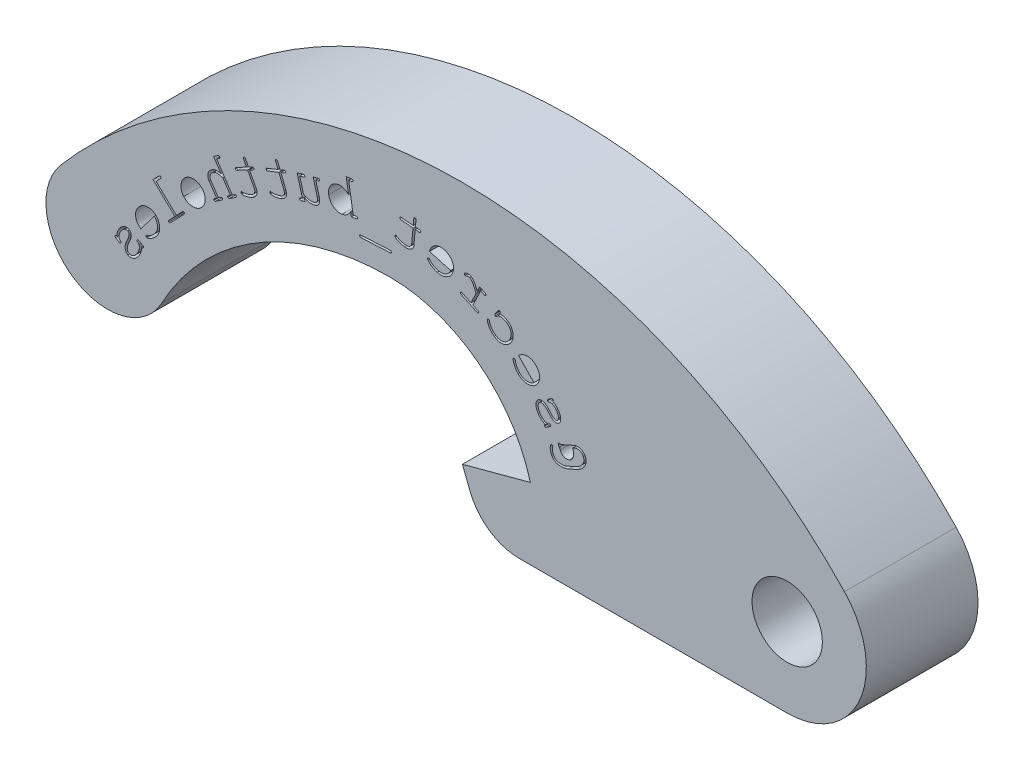
from build123d import *

# Parameters (mm, degrees)
MODEL_R             = 2
BOSS_EXTRUDE1_DEPTH = 6.35
CUT_EXTRUDE4_DEPTH  = 220.338284375
CUT_EXTRUDE5_DEPTH  = 220.338284517


with BuildPart() as part:
    # Model → Boss-Extrude1 (new body)
    with BuildSketch(Plane.XY):
        with BuildLine():
            Line((118.433937648, 164.640263764), (103.198012968, 164.640263764))
            ThreePointArc((103.198012968, 164.640263764), (101.506630698, 165.162517608), (100.404135689, 166.54744642))
            Line((100.404135689, 166.54744642), (99.969198784, 167.659398332))
            Line((99.969198784, 167.659398332), (103.83167306, 168.699250471))
            ThreePointArc((103.83167306, 168.699250471), (100.875752969, 173.113221562), (95.844125242, 174.817136699))
            ThreePointArc((95.844125242, 174.817136699), (88.287598599, 172.724441364), (82.87757448, 167.048870229))
            ThreePointArc((82.87757448, 167.048870229), (77.821451023, 165.809555926), (77.125763463, 170.968654991))
            ThreePointArc((77.125763463, 170.968654991), (99.123447873, 181.526121283), (121.689932482, 172.246466855))
            ThreePointArc((121.689932482, 172.246466855), (122.570839503, 167.369376121), (118.433937648, 164.640263764))
        make_face()
        with Locations((118.433937648, 169.140263764)):
            Circle(MODEL_R, mode=Mode.SUBTRACT)
    extrude(amount=BOSS_EXTRUDE1_DEPTH)

    # Sketch2 → Cut-Extrude4 (cut, through all)
    # profile 1 of 17: a face of its own
    with BuildSketch(Plane(origin=(0, 0, 0), x_dir=(-1, 0, 0), z_dir=(0, 0, -1))):
        with BuildLine():
            add(Edge.make_bspline(
                [(-80.331390265, 169.057090665), (-80.325645204, 169.060264297), (-80.314869422, 169.066216951), (-80.298875011, 169.072709046), (-80.283785583, 169.075014945), (-80.266278806, 169.073910566), (-80.245801928, 169.066309144), (-80.235735144, 169.053182973), (-80.23070978, 169.046630355)],
                knots=[0, 0, 0, 0, 1.03792292, 1.946790833, 2.713598056, 3.427284187, 4.715693706, 6, 6, 6, 6], degree=3))
            add(Edge.make_bspline(
                [(-80.23070978, 169.046630355), (-80.226892334, 169.038697186), (-80.219427726, 169.023184721), (-80.221106186, 169.000639635), (-80.228827611, 168.984273459), (-80.238872175, 168.972020428), (-80.252483936, 168.959748168), (-80.263561999, 168.952751285), (-80.269500097, 168.949000795)],
                knots=[0, 0, 0, 0, 1.312247149, 2.565959085, 3.243292682, 4.024589031, 4.941134223, 6, 6, 6, 6], degree=3))
            Line((-80.269500097, 168.949000795), (-80.449940445, 168.839167539))
            add(Edge.make_bspline(
                [(-80.449940445, 168.839167539), (-80.455805603, 168.835772052), (-80.466775488, 168.829421311), (-80.483462978, 168.823462962), (-80.498598396, 168.819709952), (-80.516553105, 168.821036205), (-80.537134131, 168.829889776), (-80.547500772, 168.843527822), (-80.552800161, 168.850499541)],
                knots=[0, 0, 0, 0, 1.037341292, 1.940189289, 2.71409177, 3.406650123, 4.67428905, 6, 6, 6, 6], degree=3))
            add(Edge.make_bspline(
                [(-80.552800161, 168.850499541), (-80.556349849, 168.857582038), (-80.563261901, 168.871373276), (-80.562618321, 168.89602185), (-80.549893769, 168.92041499), (-80.534423751, 168.932042161), (-80.525777694, 168.938540485)],
                knots=[0, 0, 0, 0, 0.910192009, 1.772351603, 2.75498692, 4, 4, 4, 4], degree=3))
            add(Edge.make_bspline(
                [(-80.525777694, 168.938540485), (-80.514789549, 168.948087228), (-80.493135646, 168.96690062), (-80.46964395, 169.003838979), (-80.453863235, 169.046038774), (-80.4507066, 169.076558692), (-80.449068753, 169.092394212)],
                knots=[0, 0, 0, 0, 0.98022842, 1.931697527, 2.92684359, 4, 4, 4, 4], degree=3))
            add(Edge.make_bspline(
                [(-80.449068753, 169.092394212), (-80.448693875, 169.104599942), (-80.447933952, 169.129342453), (-80.451091891, 169.167042375), (-80.458328249, 169.20528588), (-80.468323538, 169.244378206), (-80.482008666, 169.284099232), (-80.499017003, 169.324802736), (-80.51999727, 169.365999845), (-80.535951654, 169.393207893), (-80.544083236, 169.407075207)],
                knots=[0, 0, 0, 0, 0.877672697, 1.779150174, 2.713624821, 3.674022019, 4.678419261, 5.732036836, 6.844071481, 8, 8, 8, 8], degree=3))
            add(Edge.make_bspline(
                [(-80.544083236, 169.407075207), (-80.552919204, 169.421279406), (-80.570106833, 169.448909259), (-80.598037594, 169.487387433), (-80.627022035, 169.521749178), (-80.65587303, 169.553219333), (-80.686711973, 169.579464393), (-80.717381372, 169.603081866), (-80.748907706, 169.622890036), (-80.771178642, 169.632798697), (-80.782055291, 169.637637875)],
                knots=[0, 0, 0, 0, 1.191793992, 2.318264806, 3.383966265, 4.394592442, 5.3558127, 6.264769234, 7.152550356, 8, 8, 8, 8], degree=3))
            add(Edge.make_bspline(
                [(-80.782055291, 169.637637875), (-80.797726684, 169.64329931), (-80.827202292, 169.653947642), (-80.871586819, 169.660386953), (-80.912656792, 169.655522654), (-80.936132732, 169.644117818), (-80.947676867, 169.638509568)],
                knots=[0, 0, 0, 0, 1.162348917, 2.186208872, 3.108080449, 4, 4, 4, 4], degree=3))
            add(Edge.make_bspline(
                [(-80.947676867, 169.638509568), (-80.953616288, 169.634462382), (-80.965421681, 169.626418061), (-80.980799286, 169.611451538), (-80.993509771, 169.594116902), (-81.004221072, 169.574734306), (-81.011915063, 169.552769861), (-81.017122788, 169.528613884), (-81.019625676, 169.502289689), (-81.019603173, 169.484078905), (-81.019591499, 169.474631376)],
                knots=[0, 0, 0, 0, 0.915646139, 1.819968931, 2.720676319, 3.649543453, 4.63440714, 5.677696789, 6.795217848, 8, 8, 8, 8], degree=3))
            add(Edge.make_bspline(
                [(-81.019591499, 169.474631376), (-81.019105841, 169.467359023), (-81.018051894, 169.45157697), (-81.014192884, 169.426417555), (-81.006729308, 169.398507182), (-80.997742478, 169.367248223), (-80.985335629, 169.333238431), (-80.970857403, 169.295873871), (-80.954013631, 169.255541005), (-80.941232795, 169.227900632), (-80.934601479, 169.213559471)],
                knots=[0, 0, 0, 0, 0.633475753, 1.374733578, 2.207875757, 3.142945907, 4.201462919, 5.353004669, 6.62661084, 8, 8, 8, 8], degree=3))
            add(Edge.make_bspline(
                [(-80.934601479, 169.213559471), (-80.925801872, 169.194855958), (-80.90888845, 169.158906579), (-80.885839777, 169.10650563), (-80.865442491, 169.058231393), (-80.847309664, 169.01421721), (-80.832496086, 168.974036021), (-80.820384219, 168.937969533), (-80.810330286, 168.906136588), (-80.805899172, 168.885981809), (-80.803847603, 168.876650317)],
                knots=[0, 0, 0, 0, 1.370206499, 2.633626819, 3.794548302, 4.844368235, 5.788989192, 6.632620405, 7.366914781, 8, 8, 8, 8], degree=3))
            add(Edge.make_bspline(
                [(-80.803847603, 168.876650317), (-80.799775588, 168.852894582), (-80.791943432, 168.807202559), (-80.790015271, 168.740168572), (-80.797247188, 168.678116863), (-80.813452519, 168.621730353), (-80.8368094, 168.571060324), (-80.867754845, 168.527534716), (-80.903259403, 168.488775943), (-80.932257786, 168.46960076), (-80.946805175, 168.459981298)],
                knots=[0, 0, 0, 0, 1.227530163, 2.361044019, 3.405508096, 4.399410841, 5.340329871, 6.234041783, 7.114085775, 8, 8, 8, 8], degree=3))
            add(Edge.make_bspline(
                [(-80.946805175, 168.459981298), (-80.9581442, 168.453735189), (-80.98065135, 168.441337112), (-81.016889604, 168.427863774), (-81.054450824, 168.418583122), (-81.093718167, 168.414219055), (-81.134352166, 168.414901213), (-81.176586763, 168.419664777), (-81.220126812, 168.429566764), (-81.265056492, 168.443348367), (-81.310272861, 168.462328521), (-81.354734843, 168.487666998), (-81.398267413, 168.518600389), (-81.440458311, 168.555641573), (-81.4822514, 168.597519061), (-81.522193146, 168.646063715), (-81.561856446, 168.699762499), (-81.586295268, 168.738609434), (-81.59883117, 168.758535982)],
                knots=[0, 0, 0, 0, 0.778722532, 1.545708215, 2.320241784, 3.103814996, 3.91753197, 4.762945124, 5.658781778, 6.602432303, 7.590426682, 8.605100523, 9.678110295, 10.80076497, 11.982417104, 13.237057075, 14.582747482, 16, 16, 16, 16], degree=3))
            add(Edge.make_bspline(
                [(-81.59883117, 168.758535982), (-81.610754063, 168.779151312), (-81.634036095, 168.819407208), (-81.663270213, 168.881400761), (-81.687585947, 168.942684051), (-81.705356969, 169.003874732), (-81.717914571, 169.064497597), (-81.724170242, 169.124761823), (-81.726147572, 169.184768534), (-81.722043865, 169.224330372), (-81.719996428, 169.244068708)],
                knots=[0, 0, 0, 0, 1.120105204, 2.187247963, 3.221840605, 4.21906013, 5.18163432, 6.130542839, 7.067283614, 8, 8, 8, 8], degree=3))
            add(Edge.make_bspline(
                [(-81.719996428, 169.244068708), (-81.726523652, 169.240279414), (-81.738333261, 169.233423499), (-81.754387788, 169.224342), (-81.767451825, 169.218772669), (-81.78021021, 169.214111335), (-81.795110555, 169.214639488), (-81.811712854, 169.219777269), (-81.826613066, 169.230393076), (-81.833980234, 169.240081562), (-81.837674917, 169.244940401)],
                knots=[0, 0, 0, 0, 1.34054718, 2.425432238, 3.26878382, 3.864286082, 4.818666535, 5.846552794, 6.920032293, 8, 8, 8, 8], degree=3))
            add(Edge.make_bspline(
                [(-81.837674917, 169.244940401), (-81.841126486, 169.252467905), (-81.84801981, 169.267501512), (-81.846252832, 169.289430746), (-81.838774614, 169.305764215), (-81.829253777, 169.318235036), (-81.815862854, 169.33005487), (-81.805102314, 169.336778162), (-81.799320446, 169.34039073)],
                knots=[0, 0, 0, 0, 1.267799412, 2.531994269, 3.247612839, 4.035726688, 4.944554182, 6, 6, 6, 6], degree=3))
            Line((-81.799320446, 169.34039073), (-81.582704858, 169.472016299))
            add(Edge.make_bspline(
                [(-81.582704858, 169.472016299), (-81.576706, 169.475582369), (-81.565633865, 169.48216429), (-81.548747089, 169.488134656), (-81.533742389, 169.491924816), (-81.516250469, 169.490449132), (-81.495701994, 169.482758076), (-81.485817196, 169.46905985), (-81.480716835, 169.461991835)],
                knots=[0, 0, 0, 0, 1.075620556, 1.985280329, 2.765021722, 3.440390969, 4.679292161, 6, 6, 6, 6], degree=3))
            add(Edge.make_bspline(
                [(-81.480716835, 169.461991835), (-81.476911159, 169.454467042), (-81.469295125, 169.4394082), (-81.471481655, 169.413564889), (-81.482594099, 169.389057741), (-81.497339175, 169.378600418), (-81.505124225, 169.373079199)],
                knots=[0, 0, 0, 0, 0.964933952, 1.931054786, 2.907645983, 4, 4, 4, 4], degree=3))
            add(Edge.make_bspline(
                [(-81.505124225, 169.373079199), (-81.514214236, 169.367119582), (-81.531746109, 169.355625287), (-81.553567612, 169.334221385), (-81.571884769, 169.311377427), (-81.57997615, 169.294095097), (-81.584012397, 169.285474102)],
                knots=[0, 0, 0, 0, 1.086164924, 2.094882704, 3.04966489, 4, 4, 4, 4], degree=3))
            add(Edge.make_bspline(
                [(-81.584012397, 169.285474102), (-81.589007221, 169.271364183), (-81.599355586, 169.242131003), (-81.605648126, 169.193852708), (-81.605864756, 169.14105908), (-81.599676277, 169.083714275), (-81.586128227, 169.02251158), (-81.563814688, 168.958891038), (-81.534162866, 168.892453036), (-81.508763546, 168.849104084), (-81.495535608, 168.826527997)],
                knots=[0, 0, 0, 0, 0.741469552, 1.536189743, 2.401864784, 3.359414922, 4.393796286, 5.507046999, 6.701672797, 8, 8, 8, 8], degree=3))
            add(Edge.make_bspline(
                [(-81.495535608, 168.826527997), (-81.485287204, 168.80997001), (-81.465507032, 168.778011881), (-81.433313445, 168.733851565), (-81.401298707, 168.694008244), (-81.368538999, 168.659188122), (-81.335852812, 168.628526787), (-81.302086956, 168.603478843), (-81.268667234, 168.581944172), (-81.234354683, 168.566512542), (-81.201028189, 168.554800136), (-81.16893331, 168.546456204), (-81.138626151, 168.541001595), (-81.10982908, 168.5392888), (-81.082574121, 168.540359039), (-81.056958726, 168.545227669), (-81.032727829, 168.552968523), (-81.018172765, 168.560995409), (-81.010874574, 168.565020245)],
                knots=[0, 0, 0, 0, 1.542383991, 2.976914275, 4.327076217, 5.589387708, 6.762523142, 7.872213881, 8.91670091, 9.905600449, 10.844882209, 11.713202853, 12.5307476, 13.280396882, 13.994931867, 14.685801093, 15.341035204, 16, 16, 16, 16], degree=3))
            add(Edge.make_bspline(
                [(-81.010874574, 168.565020245), (-81.003191272, 168.570220302), (-80.988008914, 168.580495718), (-80.967694468, 168.598811133), (-80.950996707, 168.620147139), (-80.937338054, 168.643728872), (-80.927444491, 168.670019647), (-80.919880396, 168.698297002), (-80.916056599, 168.729228579), (-80.915927197, 168.750536745), (-80.915860091, 168.761586906)],
                knots=[0, 0, 0, 0, 0.969339685, 1.915434475, 2.845296644, 3.791025605, 4.752839339, 5.77330775, 6.845263995, 8, 8, 8, 8], degree=3))
            add(Edge.make_bspline(
                [(-80.915860091, 168.761586906), (-80.916588784, 168.773511545), (-80.918095841, 168.798173666), (-80.923288252, 168.836261192), (-80.932476807, 168.876414597), (-80.943463103, 168.91887562), (-80.958224641, 168.963280966), (-80.975746207, 169.009707465), (-80.995583339, 169.058778662), (-81.019134815, 169.108387262), (-81.042298951, 169.15769829), (-81.063155474, 169.205013544), (-81.082216445, 169.248796683), (-81.09765959, 169.289853846), (-81.111279494, 169.327445069), (-81.122868341, 169.361593001), (-81.131068135, 169.392832945), (-81.139292197, 169.429379665), (-81.144668645, 169.472440452), (-81.142985126, 169.522099746), (-81.13617614, 169.56973828), (-81.120864763, 169.614161178), (-81.100717016, 169.655093197), (-81.07501716, 169.691423642), (-81.04460873, 169.722854833), (-81.020630574, 169.738999304), (-81.008695343, 169.747035285)],
                knots=[0, 0, 0, 0, 0.802484352, 1.659669999, 2.578590833, 3.568191051, 4.605266123, 5.720207005, 6.901969519, 8.159685747, 9.408546716, 10.562080552, 11.633493149, 12.615943959, 13.508197799, 14.319947454, 15.037313, 15.676743108, 16.836536348, 17.939839011, 19.00693057, 20.056333184, 21.082093952, 22.062409208, 23.03555579, 24, 24, 24, 24], degree=3))
            add(Edge.make_bspline(
                [(-81.008695343, 169.747035285), (-80.997353964, 169.753267373), (-80.975125543, 169.765481892), (-80.93990819, 169.778860656), (-80.903703446, 169.786303316), (-80.866750462, 169.788283557), (-80.828995863, 169.785945762), (-80.790791033, 169.777061339), (-80.751595221, 169.764106168), (-80.712505042, 169.745097704), (-80.673544263, 169.72255242), (-80.635570246, 169.69689484), (-80.599300851, 169.667873245), (-80.564231543, 169.635966538), (-80.53078241, 169.600673399), (-80.498929868, 169.562213403), (-80.468753433, 169.520651223), (-80.450215047, 169.49130054), (-80.440787674, 169.476374761)],
                knots=[0, 0, 0, 0, 0.889739032, 1.743834966, 2.580973134, 3.422160074, 4.283943375, 5.174131544, 6.112998675, 7.119119057, 8.158171605, 9.208986846, 10.269033438, 11.351652618, 12.468841084, 13.611805882, 14.785525493, 16, 16, 16, 16], degree=3))
            add(Edge.make_bspline(
                [(-80.440787674, 169.476374761), (-80.430386248, 169.45848666), (-80.409922364, 169.423293407), (-80.383831115, 169.369467651), (-80.362822037, 169.316097781), (-80.346460616, 169.263404086), (-80.334879211, 169.211079574), (-80.329137639, 169.159096688), (-80.326723431, 169.10772787), (-80.329838181, 169.073931457), (-80.331390265, 169.057090665)],
                knots=[0, 0, 0, 0, 1.124782733, 2.212910357, 3.248505898, 4.240432589, 5.210318306, 6.156793748, 7.08152816, 8, 8, 8, 8], degree=3))
        make_face()
    # profile 2 of 17: a face of its own
    with BuildSketch(Plane(origin=(0, 0, 0), x_dir=(-1, 0, 0), z_dir=(0, 0, -1))):
        with BuildLine():
            Line((-81.683310789, 170.111520718), (-82.452579426, 171.114402947))
            add(Edge.make_bspline(
                [(-82.452579426, 171.114402947), (-82.466183844, 171.099938845), (-82.492914895, 171.071518618), (-82.52837566, 171.025884724), (-82.559032176, 170.978665821), (-82.585001953, 170.929766182), (-82.605387895, 170.878982361), (-82.621276173, 170.826792932), (-82.632085483, 170.773076235), (-82.638277025, 170.718242861), (-82.63911064, 170.662928458), (-82.634816796, 170.60804522), (-82.625121672, 170.553892343), (-82.610103897, 170.50074153), (-82.590657573, 170.447991417), (-82.564785641, 170.396615823), (-82.535139193, 170.345329572), (-82.511305437, 170.313103246), (-82.499214976, 170.296755376)],
                knots=[0, 0, 0, 0, 1.058124071, 2.079087058, 3.075880583, 4.056321926, 5.025687957, 5.988596856, 6.960712692, 7.942590759, 8.926330382, 9.905271619, 10.873027406, 11.853927507, 12.846529827, 13.864874918, 14.916887133, 16, 16, 16, 16], degree=3))
            add(Edge.make_bspline(
                [(-82.499214976, 170.296755376), (-82.484546316, 170.278483247), (-82.454755374, 170.241373932), (-82.403721567, 170.189605885), (-82.347361572, 170.139998384), (-82.286912302, 170.093030795), (-82.224092371, 170.051510741), (-82.161352002, 170.016714409), (-82.100110098, 169.989052349), (-82.058582694, 169.976705668), (-82.038525486, 169.970742378)],
                knots=[0, 0, 0, 0, 0.980551733, 1.991426605, 3.038618498, 4.12270284, 5.194015031, 6.187779438, 7.124720477, 8, 8, 8, 8], degree=3))
            add(Edge.make_bspline(
                [(-82.038525486, 169.970742378), (-82.028283997, 169.968145942), (-82.010377671, 169.963606305), (-81.997126346, 169.950901578), (-81.99145409, 169.945463295)],
                knots=[0, 0, 0, 0, 1.143896047, 2, 2, 2, 2], degree=3))
            add(Edge.make_bspline(
                [(-81.99145409, 169.945463295), (-81.987406242, 169.93884104), (-81.979180324, 169.925383488), (-81.979977438, 169.901088862), (-81.987060213, 169.87758974), (-81.998989757, 169.866476033), (-82.004965324, 169.860909122)],
                knots=[0, 0, 0, 0, 0.966362021, 1.963812506, 2.980063695, 4, 4, 4, 4], degree=3))
            add(Edge.make_bspline(
                [(-82.004965324, 169.860909122), (-82.012506146, 169.856828562), (-82.028923256, 169.847944783), (-82.047603057, 169.849570065), (-82.057702721, 169.850448812)],
                knots=[0, 0, 0, 0, 0.918654006, 2, 2, 2, 2], degree=3))
            add(Edge.make_bspline(
                [(-82.057702721, 169.850448812), (-82.066595235, 169.851745671), (-82.08497806, 169.854426571), (-82.113348067, 169.861805694), (-82.143576378, 169.871618215), (-82.175498298, 169.885157765), (-82.209464568, 169.900530333), (-82.244987776, 169.919784043), (-82.282570365, 169.941292901), (-82.33503325, 169.973880263), (-82.399125951, 170.019591378), (-82.471193173, 170.081037725), (-82.53862649, 170.147423738), (-82.577992297, 170.19667634), (-82.597716229, 170.221353974)],
                knots=[0, 0, 0, 0, 0.483852041, 1.000230958, 1.576976146, 2.194755264, 2.867193252, 3.585023999, 4.370471621, 5.200188499, 6.911767919, 8.60557113, 10.299247731, 12, 12, 12, 12], degree=3))
            add(Edge.make_bspline(
                [(-82.597716229, 170.221353974), (-82.613044415, 170.242464889), (-82.643106948, 170.283868848), (-82.681327501, 170.349249482), (-82.712010283, 170.416113281), (-82.735204651, 170.48451152), (-82.751407019, 170.554143258), (-82.760762643, 170.625240543), (-82.76225036, 170.697673245), (-82.757136769, 170.770655584), (-82.744878005, 170.842390796), (-82.726886934, 170.9116036), (-82.701614843, 170.976801369), (-82.671153231, 171.038795258), (-82.633983421, 171.097074146), (-82.589886912, 171.151042736), (-82.540603751, 171.20236797), (-82.503340719, 171.232468698), (-82.484396203, 171.247771901)],
                knots=[0, 0, 0, 0, 1.087238358, 2.132355317, 3.151504455, 4.149481152, 5.138316731, 6.127801425, 7.13359675, 8.153807362, 9.173514361, 10.163795959, 11.130112405, 12.083643568, 13.039730116, 14.004640678, 14.985559856, 16, 16, 16, 16], degree=3))
            add(Edge.make_bspline(
                [(-82.484396203, 171.247771901), (-82.466505002, 171.260827687), (-82.43115596, 171.286623024), (-82.373973708, 171.317695465), (-82.315557949, 171.343499361), (-82.254867333, 171.361657646), (-82.192553371, 171.373933775), (-82.128305065, 171.380262747), (-82.062028022, 171.378944312), (-81.994785524, 171.372134157), (-81.927914195, 171.359189936), (-81.863204197, 171.34003218), (-81.801415426, 171.314642007), (-81.742716492, 171.283078215), (-81.687070551, 171.245396854), (-81.634784331, 171.201488257), (-81.584864602, 171.152013972), (-81.555113104, 171.115001644), (-81.539917372, 171.096097405)],
                knots=[0, 0, 0, 0, 0.997231303, 1.970307715, 2.926404101, 3.870950389, 4.818668889, 5.785579045, 6.774412415, 7.801257672, 8.828603869, 9.839627255, 10.837954335, 11.83402409, 12.838345896, 13.861174793, 14.907583916, 16, 16, 16, 16], degree=3))
            add(Edge.make_bspline(
                [(-81.539917372, 171.096097405), (-81.525286782, 171.076016861), (-81.496617718, 171.036668453), (-81.461024522, 170.974259905), (-81.431217636, 170.911416113), (-81.409427995, 170.846867139), (-81.394458517, 170.781150633), (-81.386639616, 170.71423245), (-81.385752952, 170.646307571), (-81.392077592, 170.578032347), (-81.404260777, 170.51043222), (-81.424218195, 170.445078982), (-81.450369324, 170.382278467), (-81.483824252, 170.322384659), (-81.523730624, 170.265060742), (-81.570119808, 170.210323467), (-81.623577533, 170.158685127), (-81.663124954, 170.127459125), (-81.683310789, 170.111520718)],
                knots=[0, 0, 0, 0, 1.065739697, 2.088347784, 3.078827441, 4.047148934, 5.00633007, 5.967070998, 6.933784584, 7.91677543, 8.906312259, 9.876980521, 10.844096333, 11.821134415, 12.815865288, 13.837959812, 14.896449246, 16, 16, 16, 16], degree=3))
        make_face()
        with BuildLine():
            add(Edge.make_bspline(
                [(-81.660210937, 170.287166758), (-81.648921716, 170.30004194), (-81.626625034, 170.325470961), (-81.597817521, 170.366716408), (-81.573458184, 170.409593479), (-81.552724289, 170.453648424), (-81.536688171, 170.499269366), (-81.524251807, 170.546149086), (-81.51643186, 170.5947656), (-81.513177382, 170.644502986), (-81.513439336, 170.694649689), (-81.518233332, 170.744248127), (-81.527361523, 170.792847101), (-81.541122547, 170.840340092), (-81.558870883, 170.886942893), (-81.581393107, 170.932477419), (-81.607935082, 170.977182546), (-81.628729698, 171.005462324), (-81.639290317, 171.01982431)],
                knots=[0, 0, 0, 0, 1.028557722, 2.031444359, 3.017000202, 3.989708037, 4.953557678, 5.919303886, 6.901178293, 7.90774526, 8.911923445, 9.911955181, 10.898361609, 11.879459216, 12.879986385, 13.891389375, 14.929134619, 16, 16, 16, 16], degree=3))
            add(Edge.make_bspline(
                [(-81.639290317, 171.01982431), (-81.650414686, 171.033659606), (-81.672424122, 171.061032578), (-81.708558229, 171.098387214), (-81.746711812, 171.131834655), (-81.78688579, 171.161069542), (-81.829079696, 171.186469418), (-81.873062783, 171.208522441), (-81.919469589, 171.225813041), (-81.967313212, 171.239209011), (-82.015939975, 171.249023976), (-82.064856685, 171.25367793), (-82.113567242, 171.254173336), (-82.162001534, 171.250237788), (-82.210132372, 171.241900209), (-82.258007209, 171.229183247), (-82.3056625, 171.21168544), (-82.3366107, 171.196887172), (-82.352334788, 171.189368503)],
                knots=[0, 0, 0, 0, 1.066244991, 2.109553416, 3.117951197, 4.1114281, 5.090496228, 6.074261642, 7.063241499, 8.060851529, 9.057200479, 10.0395707, 11.008547089, 11.980663904, 12.955090301, 13.939668665, 14.953191753, 16, 16, 16, 16], degree=3))
            Line((-82.352334788, 171.189368503), (-81.660210937, 170.287166758))
        make_face(mode=Mode.SUBTRACT)
    # profile 3 of 17: a face of its own
    with BuildSketch(Plane(origin=(0, 0, 0), x_dir=(-1, 0, 0), z_dir=(0, 0, -1))):
        with BuildLine():
            Line((-82.380860667, 172.881128906), (-83.624765874, 171.692576172))
            Line((-83.624765874, 171.692576172), (-83.289600105, 171.341719938))
            add(Edge.make_bspline(
                [(-83.289600105, 171.341719938), (-83.284774466, 171.336630207), (-83.275752922, 171.327114941), (-83.265802102, 171.311865317), (-83.258986946, 171.297514055), (-83.256355957, 171.279876497), (-83.259261776, 171.257598866), (-83.270623911, 171.244691722), (-83.276524718, 171.23798853)],
                knots=[0, 0, 0, 0, 1.061229244, 1.983970654, 2.753535343, 3.445372167, 4.673280487, 6, 6, 6, 6], degree=3))
            add(Edge.make_bspline(
                [(-83.276524718, 171.23798853), (-83.283030438, 171.232908795), (-83.296120916, 171.222687614), (-83.317915668, 171.220816147), (-83.335766277, 171.223889976), (-83.349770299, 171.231687438), (-83.364801535, 171.242043389), (-83.37401096, 171.251320275), (-83.378948587, 171.256294073)],
                knots=[0, 0, 0, 0, 1.242444291, 2.499982767, 3.203563832, 4.000771649, 4.928114883, 6, 6, 6, 6], degree=3))
            Line((-83.378948587, 171.256294073), (-84.134270145, 172.046919177))
            add(Edge.make_bspline(
                [(-84.134270145, 172.046919177), (-84.138921696, 172.05202755), (-84.147538344, 172.061490428), (-84.15741806, 172.076412976), (-84.163370535, 172.090653277), (-84.166463569, 172.10808679), (-84.162211318, 172.129443534), (-84.151717997, 172.142130765), (-84.14647384, 172.148471354)],
                knots=[0, 0, 0, 0, 1.075312135, 1.991935011, 2.773722992, 3.462121046, 4.731666126, 6, 6, 6, 6], degree=3))
            add(Edge.make_bspline(
                [(-84.14647384, 172.148471354), (-84.139593225, 172.154085835), (-84.126344764, 172.164896385), (-84.104185922, 172.16703244), (-84.086895441, 172.16376831), (-84.073084273, 172.156618613), (-84.05878436, 172.14608996), (-84.049745258, 172.137127656), (-84.044921663, 172.132345042)],
                knots=[0, 0, 0, 0, 1.341834211, 2.583669688, 3.268921283, 4.040276597, 4.954219889, 6, 6, 6, 6], degree=3))
            Line((-84.044921663, 172.132345042), (-83.709755894, 171.781488808))
            Line((-83.709755894, 171.781488808), (-82.556070861, 172.883743983))
            Line((-82.556070861, 172.883743983), (-82.801888148, 173.140893273))
            add(Edge.make_bspline(
                [(-82.801888148, 173.140893273), (-82.806546956, 173.145997936), (-82.815177048, 173.155453942), (-82.825075921, 173.170579733), (-82.831392586, 173.185040156), (-82.835092332, 173.202965273), (-82.831308617, 173.225630213), (-82.819906268, 173.238787201), (-82.814091843, 173.245496374)],
                knots=[0, 0, 0, 0, 1.042168, 1.930537989, 2.716901799, 3.409560883, 4.679051596, 6, 6, 6, 6], degree=3))
            add(Edge.make_bspline(
                [(-82.814091843, 173.245496374), (-82.807460712, 173.250757879), (-82.794395332, 173.261124674), (-82.772559379, 173.263098684), (-82.754848049, 173.260028351), (-82.740856158, 173.252224642), (-82.725685604, 173.241867997), (-82.716581453, 173.232335493), (-82.711667973, 173.227190831)],
                knots=[0, 0, 0, 0, 1.268142395, 2.498633164, 3.199400754, 3.993420703, 4.917055683, 6, 6, 6, 6], degree=3))
            Line((-82.711667973, 173.227190831), (-82.380860667, 172.881128906))
        make_face()
    # profile 4 of 17: a face of its own
    with BuildSketch(Plane(origin=(0, 0, 0), x_dir=(-1, 0, 0), z_dir=(0, 0, -1))):
        with BuildLine():
            add(Edge.make_bspline(
                [(-84.127367272, 172.925429235), (-84.142843638, 172.907932709), (-84.173265488, 172.873539836), (-84.224547584, 172.828617795), (-84.278167087, 172.789052831), (-84.335254256, 172.755661319), (-84.395751234, 172.728506164), (-84.459489147, 172.707703935), (-84.526325561, 172.692719306), (-84.595369388, 172.684375661), (-84.665099658, 172.681384671), (-84.733536677, 172.685973109), (-84.800004739, 172.696298262), (-84.864378975, 172.713484098), (-84.926870596, 172.736879219), (-84.986823204, 172.767575685), (-85.045439275, 172.80345195), (-85.081449889, 172.832605298), (-85.099740263, 172.847412756)],
                knots=[0, 0, 0, 0, 1.03263748, 2.02985267, 3.009593504, 3.977602017, 4.950125002, 5.938077126, 6.939324408, 7.975856198, 9.011530501, 10.02281833, 11.005675342, 11.983326162, 12.965930879, 13.951998994, 14.959787085, 16, 16, 16, 16], degree=3))
            add(Edge.make_bspline(
                [(-85.099740263, 172.847412756), (-85.117525651, 172.863034937), (-85.152640925, 172.893879201), (-85.198539308, 172.94575347), (-85.23939238, 172.999858516), (-85.272619343, 173.05787303), (-85.301201086, 173.118240771), (-85.322147936, 173.182346538), (-85.3382168, 173.249192625), (-85.346898729, 173.318459), (-85.350171539, 173.388010375), (-85.346715554, 173.456334836), (-85.336741532, 173.52250972), (-85.319998588, 173.586406968), (-85.297224512, 173.648370508), (-85.267955323, 173.708136685), (-85.232092658, 173.765767681), (-85.203558816, 173.801320413), (-85.189088745, 173.819349901)],
                knots=[0, 0, 0, 0, 1.045772313, 2.064761372, 3.056660088, 4.038375349, 5.015603298, 6.004939906, 7.014673096, 8.051349065, 9.086610836, 10.090091748, 11.071323452, 12.040494275, 13.005931967, 13.985648384, 14.978482805, 16, 16, 16, 16], degree=3))
            add(Edge.make_bspline(
                [(-85.189088745, 173.819349901), (-85.173777896, 173.836865849), (-85.14361884, 173.871368473), (-85.092315597, 173.916124052), (-85.038672893, 173.955886163), (-84.981364004, 173.988870831), (-84.921176511, 174.016338089), (-84.857645011, 174.036999001), (-84.791069079, 174.052628184), (-84.721945184, 174.060846339), (-84.652253659, 174.063665737), (-84.583612621, 174.059860164), (-84.516998753, 174.049096777), (-84.452113192, 174.033084464), (-84.389864753, 174.008250669), (-84.329120304, 173.97836277), (-84.270299428, 173.941673624), (-84.23387404, 173.912560901), (-84.215408215, 173.897802227)],
                knots=[0, 0, 0, 0, 1.026812882, 2.022599007, 3.000935818, 3.973104093, 4.938381695, 5.918822096, 6.920055353, 7.955101735, 8.989291859, 9.99874275, 10.986531297, 11.967370871, 12.944864978, 13.941002762, 14.956192801, 16, 16, 16, 16], degree=3))
            add(Edge.make_bspline(
                [(-84.215408215, 173.897802227), (-84.197819871, 173.882132022), (-84.163249722, 173.851332002), (-84.117138038, 173.800317045), (-84.077284016, 173.746120788), (-84.043678422, 173.688603192), (-84.015282535, 173.628264071), (-83.994347517, 173.564313285), (-83.978285088, 173.497595654), (-83.969147721, 173.428525134), (-83.965253361, 173.358950539), (-83.969051164, 173.290667601), (-83.978290626, 173.224267399), (-83.995230845, 173.160147623), (-84.017723247, 173.09770842), (-84.047782394, 173.037862987), (-84.084026115, 172.979814878), (-84.1127607, 172.943757951), (-84.127367272, 172.925429235)],
                knots=[0, 0, 0, 0, 1.040780806, 2.045670105, 3.033502989, 4.009426118, 4.986405327, 5.975490112, 6.978715601, 8.015983028, 9.051280146, 10.054505635, 11.03454104, 12.009681934, 12.9809022, 13.963207766, 14.964643121, 16, 16, 16, 16], degree=3))
        make_face()
        with BuildLine():
            add(Edge.make_bspline(
                [(-84.223689294, 173.006496638), (-84.211752769, 173.021375844), (-84.188128801, 173.05082377), (-84.158615593, 173.098424912), (-84.134584478, 173.147742899), (-84.114866869, 173.198286844), (-84.102284133, 173.250990285), (-84.093529813, 173.305030789), (-84.091256335, 173.360850178), (-84.09381839, 173.417735435), (-84.101566514, 173.474045139), (-84.114134856, 173.528715888), (-84.132271561, 173.58071621), (-84.154657943, 173.630635723), (-84.183098927, 173.677502966), (-84.215789026, 173.722221544), (-84.253827255, 173.764250621), (-84.282423044, 173.789539145), (-84.296911464, 173.802351897)],
                knots=[0, 0, 0, 0, 1.02879767, 2.036127301, 3.014477199, 3.987249895, 4.957111038, 5.932975615, 6.937708047, 7.965937857, 9.002741855, 10.001244232, 10.988134461, 11.970591732, 12.948187264, 13.940885064, 14.956723211, 16, 16, 16, 16], degree=3))
            add(Edge.make_bspline(
                [(-84.296911464, 173.802351897), (-84.312101278, 173.814407622), (-84.34197974, 173.838121311), (-84.389883524, 173.868319211), (-84.439335772, 173.893329784), (-84.490522363, 173.913124583), (-84.543579542, 173.927205608), (-84.598267186, 173.935137171), (-84.654416688, 173.93898646), (-84.7114386, 173.936382356), (-84.768112204, 173.929858052), (-84.822785403, 173.917428547), (-84.874946735, 173.900682227), (-84.924121231, 173.878006067), (-84.970894919, 173.850979839), (-85.015203393, 173.819094064), (-85.056411876, 173.781670919), (-85.081385194, 173.753767768), (-85.094074262, 173.739590037)],
                knots=[0, 0, 0, 0, 1.046031925, 2.057551515, 3.049926216, 4.032838842, 5.014217793, 6.005600739, 7.011207276, 8.046961733, 9.081766011, 10.086179639, 11.068090953, 12.033043992, 13.002700426, 13.979841496, 14.973547309, 16, 16, 16, 16], degree=3))
            add(Edge.make_bspline(
                [(-85.094074262, 173.739590037), (-85.105880651, 173.724862244), (-85.129246665, 173.695714482), (-85.158147956, 173.648396692), (-85.182603576, 173.599678457), (-85.201248455, 173.548916479), (-85.215038053, 173.496403438), (-85.222527636, 173.441991476), (-85.225864787, 173.385990301), (-85.223027501, 173.328928892), (-85.215342726, 173.272325802), (-85.202587157, 173.21748771), (-85.185403691, 173.165037557), (-85.162360914, 173.115319223), (-85.134440771, 173.068159375), (-85.101345477, 173.023577979), (-85.064112225, 172.980824121), (-85.035396835, 172.955626188), (-85.020852091, 172.942863085)],
                knots=[0, 0, 0, 0, 1.017934538, 2.01459331, 2.986036692, 3.956181501, 4.928099538, 5.910683618, 6.91594344, 7.952139691, 8.989077513, 9.995346187, 10.98727359, 11.962728412, 12.947188251, 13.940014182, 14.956588551, 16, 16, 16, 16], degree=3))
            add(Edge.make_bspline(
                [(-85.020852091, 172.942863085), (-85.005656449, 172.930819035), (-84.975766524, 172.907128312), (-84.928001001, 172.876798482), (-84.878304776, 172.852423285), (-84.827258401, 172.832487334), (-84.774316347, 172.818512637), (-84.71979278, 172.81046266), (-84.663786475, 172.806714091), (-84.6067227, 172.809108241), (-84.550125925, 172.81638241), (-84.495402456, 172.828602545), (-84.443151699, 172.845513499), (-84.393751536, 172.867981877), (-84.346902189, 172.894964812), (-84.302943093, 172.927283207), (-84.261343899, 172.964243047), (-84.236351511, 172.992287907), (-84.223689294, 173.006496638)],
                knots=[0, 0, 0, 0, 1.046270663, 2.058021114, 3.047114925, 4.030251883, 5.011854816, 5.995711001, 7.00154705, 8.037537899, 9.073558433, 10.078201301, 11.060336718, 12.032653052, 13.002530793, 13.973549417, 14.97331304, 16, 16, 16, 16], degree=3))
        make_face(mode=Mode.SUBTRACT)
    # profile 5 of 17: a face of its own
    with BuildSketch(Plane(origin=(0, 0, 0), x_dir=(-1, 0, 0), z_dir=(0, 0, -1))):
        with BuildLine():
            Line((-85.820525165, 175.742863612), (-86.246346954, 175.109143159))
            add(Edge.make_bspline(
                [(-86.246346954, 175.109143159), (-86.219256869, 175.115073056), (-86.167409001, 175.126422321), (-86.091896508, 175.136241224), (-86.022558439, 175.138655037), (-85.958420974, 175.134205219), (-85.897939867, 175.121454496), (-85.839233784, 175.102262611), (-85.781543114, 175.075509147), (-85.745315154, 175.052475568), (-85.72681822, 175.040715297)],
                knots=[0, 0, 0, 0, 1.228276715, 2.350805842, 3.368324606, 4.297919883, 5.191681095, 6.099516704, 7.029668938, 8, 8, 8, 8], degree=3))
            add(Edge.make_bspline(
                [(-85.72681822, 175.040715297), (-85.707774943, 175.027305413), (-85.671060763, 175.001452043), (-85.622629325, 174.957558152), (-85.582585459, 174.911084543), (-85.550268065, 174.862189515), (-85.525484994, 174.810615514), (-85.508265107, 174.75574433), (-85.49878582, 174.697482559), (-85.497032575, 174.637074239), (-85.501003791, 174.576712509), (-85.514735275, 174.51896882), (-85.534542716, 174.464056065), (-85.554927465, 174.431244784), (-85.56511926, 174.414840077)],
                knots=[0, 0, 0, 0, 1.160882994, 2.23810568, 3.250421177, 4.213100645, 5.153011988, 6.094932286, 7.07177056, 8.086883086, 9.104475407, 10.078298907, 11.0392041, 12, 12, 12, 12], degree=3))
            Line((-85.56511926, 174.414840077), (-85.99442782, 173.77588947))
            Line((-85.99442782, 173.77588947), (-85.879364409, 173.698744683))
            add(Edge.make_bspline(
                [(-85.879364409, 173.698744683), (-85.873597655, 173.694668689), (-85.862879924, 173.6870933), (-85.849433422, 173.674587412), (-85.84055713, 173.661634658), (-85.833207113, 173.645584743), (-85.832953348, 173.623347534), (-85.841132465, 173.608700677), (-85.845368401, 173.601115122)],
                knots=[0, 0, 0, 0, 1.079533898, 2.006354595, 2.788850778, 3.4655105, 4.687396811, 6, 6, 6, 6], degree=3))
            add(Edge.make_bspline(
                [(-85.845368401, 173.601115122), (-85.850580363, 173.594748622), (-85.861110909, 173.58188538), (-85.881623515, 173.574155548), (-85.899608627, 173.573442432), (-85.914910118, 173.577446016), (-85.931487141, 173.585127438), (-85.94264062, 173.592112657), (-85.948663963, 173.595884967)],
                knots=[0, 0, 0, 0, 1.244571415, 2.514603282, 3.205575322, 3.983706564, 4.911117514, 6, 6, 6, 6], degree=3))
            Line((-85.948663963, 173.595884967), (-86.283393886, 173.820781634))
            add(Edge.make_bspline(
                [(-86.283393886, 173.820781634), (-86.289162555, 173.82485672), (-86.299883845, 173.832430423), (-86.313307709, 173.844947035), (-86.322328426, 173.857978586), (-86.32954136, 173.874569778), (-86.329778182, 173.896669545), (-86.322370744, 173.911495115), (-86.318697432, 173.918847041)],
                knots=[0, 0, 0, 0, 1.079899899, 2.00703482, 2.789796299, 3.487163743, 4.75389718, 6, 6, 6, 6], degree=3))
            add(Edge.make_bspline(
                [(-86.318697432, 173.918847041), (-86.313110021, 173.925605187), (-86.302226267, 173.938769423), (-86.281001563, 173.945988504), (-86.263153085, 173.945944221), (-86.247846242, 173.942127391), (-86.231271778, 173.934383684), (-86.220117894, 173.927408331), (-86.214094331, 173.92364135)],
                knots=[0, 0, 0, 0, 1.309577608, 2.550934283, 3.234418745, 4.004518292, 4.922356714, 6, 6, 6, 6], degree=3))
            Line((-86.214094331, 173.92364135), (-86.098595074, 173.846060716))
            Line((-86.098595074, 173.846060716), (-85.67451667, 174.477601938))
            add(Edge.make_bspline(
                [(-85.67451667, 174.477601938), (-85.668699853, 174.486956338), (-85.657323471, 174.505251437), (-85.643047258, 174.533839588), (-85.632648893, 174.563310744), (-85.625170005, 174.593211916), (-85.621139991, 174.62377617), (-85.620870771, 174.654757), (-85.623505691, 174.686274771), (-85.629167997, 174.718117588), (-85.638035022, 174.749872194), (-85.651568425, 174.780423963), (-85.667586859, 174.810473595), (-85.68794136, 174.839159686), (-85.711418442, 174.867155407), (-85.738793174, 174.893722241), (-85.769199263, 174.919616817), (-85.791615772, 174.935139372), (-85.803091314, 174.943085737)],
                knots=[0, 0, 0, 0, 0.973589246, 1.904121099, 2.818197891, 3.730920159, 4.62464813, 5.536647163, 6.464604926, 7.416952161, 8.392572541, 9.370725908, 10.365020544, 11.398286717, 12.473795376, 13.590909193, 14.766729288, 16, 16, 16, 16], degree=3))
            add(Edge.make_bspline(
                [(-85.803091314, 174.943085737), (-85.821660133, 174.954733825), (-85.857654647, 174.977312927), (-85.915748435, 175.000417671), (-85.974100646, 175.014786737), (-86.013379947, 175.016096691), (-86.03278229, 175.016743753)],
                knots=[0, 0, 0, 0, 1.072222011, 2.078436407, 3.050827367, 4, 4, 4, 4], degree=3))
            add(Edge.make_bspline(
                [(-86.03278229, 175.016743753), (-86.040491014, 175.016577485), (-86.057557238, 175.016209386), (-86.085408618, 175.012598759), (-86.117997928, 175.008456187), (-86.155101636, 175.002362288), (-86.19652082, 174.993673146), (-86.242726059, 174.98447719), (-86.293275214, 174.972290031), (-86.3285729, 174.963988269), (-86.347027439, 174.959647894)],
                knots=[0, 0, 0, 0, 0.578095637, 1.279837027, 2.104549515, 3.043507244, 4.099485803, 5.27947663, 6.577640433, 8, 8, 8, 8], degree=3))
            Line((-86.347027439, 174.959647894), (-86.785052924, 174.307186053))
            Line((-86.785052924, 174.307186053), (-86.668681974, 174.229169573))
            add(Edge.make_bspline(
                [(-86.668681974, 174.229169573), (-86.663016679, 174.225279264), (-86.652428971, 174.218008778), (-86.639817128, 174.205315696), (-86.630471215, 174.192794971), (-86.623636727, 174.176496622), (-86.622531655, 174.154127013), (-86.630805895, 174.139282857), (-86.635121812, 174.131540013)],
                knots=[0, 0, 0, 0, 1.052620145, 1.967211475, 2.734555181, 3.434449066, 4.661785766, 6, 6, 6, 6], degree=3))
            add(Edge.make_bspline(
                [(-86.635121812, 174.131540013), (-86.640472802, 174.125164792), (-86.6511823, 174.112405393), (-86.671870007, 174.104784631), (-86.689809444, 174.104869083), (-86.704994497, 174.108786767), (-86.721508579, 174.115727126), (-86.732269457, 174.122640246), (-86.737981528, 174.126309857)],
                knots=[0, 0, 0, 0, 1.271090144, 2.543966504, 3.240533761, 4.025374029, 4.951832215, 6, 6, 6, 6], degree=3))
            Line((-86.737981528, 174.126309857), (-87.07401899, 174.352078217))
            add(Edge.make_bspline(
                [(-87.07401899, 174.352078217), (-87.079736213, 174.35592319), (-87.09033607, 174.363051854), (-87.102338423, 174.376249817), (-87.112390859, 174.388194309), (-87.118519824, 174.405218797), (-87.119198641, 174.427043627), (-87.111722419, 174.441903162), (-87.108014997, 174.449271931)],
                knots=[0, 0, 0, 0, 1.062231278, 1.969400223, 2.757043438, 3.455033161, 4.737963787, 6, 6, 6, 6], degree=3))
            add(Edge.make_bspline(
                [(-87.108014997, 174.449271931), (-87.102427282, 174.456030742), (-87.091542937, 174.469196272), (-87.070321865, 174.476407404), (-87.05246509, 174.476381279), (-87.037377187, 174.472542575), (-87.021104097, 174.465392621), (-87.010440005, 174.458588101), (-87.004719435, 174.454937933)],
                knots=[0, 0, 0, 0, 1.326876029, 2.584629982, 3.2771427, 4.057414615, 4.95793333, 6, 6, 6, 6], degree=3))
            Line((-87.004719435, 174.454937933), (-86.888348486, 174.376485607))
            Line((-86.888348486, 174.376485607), (-85.993991973, 175.707995912))
            Line((-85.993991973, 175.707995912), (-86.132155236, 175.800831164))
            add(Edge.make_bspline(
                [(-86.132155236, 175.800831164), (-86.137782165, 175.804915692), (-86.148154299, 175.812444715), (-86.161218633, 175.824877459), (-86.170823289, 175.837356496), (-86.177129865, 175.854359793), (-86.177868505, 175.876891452), (-86.169546973, 175.892013449), (-86.165279551, 175.899768263)],
                knots=[0, 0, 0, 0, 1.054637824, 1.944016932, 2.733975391, 3.41827734, 4.676049337, 6, 6, 6, 6], degree=3))
            add(Edge.make_bspline(
                [(-86.165279551, 175.899768263), (-86.15994505, 175.906212182), (-86.149389786, 175.91896263), (-86.12861356, 175.925804073), (-86.110743998, 175.92662921), (-86.095398555, 175.922480444), (-86.078806711, 175.915499527), (-86.067849902, 175.908660048), (-86.061983989, 175.904998418)],
                knots=[0, 0, 0, 0, 1.268286359, 2.50953153, 3.227332871, 4.010441929, 4.934856523, 6, 6, 6, 6], degree=3))
            Line((-86.061983989, 175.904998418), (-85.820525165, 175.742863612))
        make_face()
    # profile 6 of 17: a face of its own
    with BuildSketch(Plane(origin=(0, 0, 0), x_dir=(-1, 0, 0), z_dir=(0, 0, -1))):
        with BuildLine():
            Line((-87.698301332, 176.153810257), (-87.102063657, 175.840872647))
            add(Edge.make_bspline(
                [(-87.102063657, 175.840872647), (-87.096028467, 175.837366895), (-87.084889737, 175.830896573), (-87.070418404, 175.820029706), (-87.060015776, 175.808153017), (-87.05206031, 175.792022881), (-87.048240174, 175.769828465), (-87.05500395, 175.753993715), (-87.058479032, 175.745858163)],
                knots=[0, 0, 0, 0, 1.060276701, 1.956879095, 2.740001929, 3.431200139, 4.680206228, 6, 6, 6, 6], degree=3))
            add(Edge.make_bspline(
                [(-87.058479032, 175.745858163), (-87.063044913, 175.738938465), (-87.0722597, 175.724973245), (-87.092101472, 175.715378899), (-87.110077036, 175.712830631), (-87.125599199, 175.715678304), (-87.142824084, 175.720843946), (-87.154299098, 175.726624653), (-87.160467055, 175.729731852)],
                knots=[0, 0, 0, 0, 1.257272749, 2.537406875, 3.236386533, 4.027014661, 4.939496802, 6, 6, 6, 6], degree=3))
            Line((-87.160467055, 175.729731852), (-87.75670473, 176.042669462))
            Line((-87.75670473, 176.042669462), (-88.140249433, 175.311755295))
            add(Edge.make_bspline(
                [(-88.140249433, 175.311755295), (-88.147405675, 175.295882572), (-88.161419806, 175.264798877), (-88.169246668, 175.21387923), (-88.165104096, 175.162175152), (-88.151613882, 175.11962667), (-88.135883967, 175.085841213), (-88.119923926, 175.061032457), (-88.101098151, 175.036826591), (-88.078666615, 175.013699171), (-88.05287888, 174.991540679), (-88.023848424, 174.97028844), (-87.99217651, 174.949037264), (-87.96908121, 174.936726303), (-87.957194006, 174.930389823)],
                knots=[0, 0, 0, 0, 1.314704038, 2.574596583, 3.855673295, 5.2140532, 5.933126958, 6.67542936, 7.444129012, 8.253993871, 9.112685304, 10.017773459, 10.979743514, 12, 12, 12, 12], degree=3))
            add(Edge.make_bspline(
                [(-87.957194006, 174.930389823), (-87.938020896, 174.920755063), (-87.898898298, 174.901095402), (-87.83596014, 174.87736598), (-87.769470218, 174.854670887), (-87.699850917, 174.836767996), (-87.631503155, 174.822152133), (-87.567798708, 174.812025255), (-87.510709843, 174.806160341), (-87.474868302, 174.806466622), (-87.458150046, 174.806609487)],
                knots=[0, 0, 0, 0, 0.992311365, 2.024804384, 3.109079172, 4.242434102, 5.348725297, 6.34240223, 7.22681496, 8, 8, 8, 8], degree=3))
            add(Edge.make_bspline(
                [(-87.458150046, 174.806609487), (-87.447719776, 174.807622017), (-87.429803847, 174.809361226), (-87.41290796, 174.803424131), (-87.405848496, 174.800943486)],
                knots=[0, 0, 0, 0, 1.164357075, 2, 2, 2, 2], degree=3))
            add(Edge.make_bspline(
                [(-87.405848496, 174.800943486), (-87.399516227, 174.796608152), (-87.386521211, 174.787711227), (-87.37678062, 174.765388795), (-87.373750958, 174.741039732), (-87.379764425, 174.726021454), (-87.382748644, 174.718568544)],
                knots=[0, 0, 0, 0, 0.960065417, 1.97023629, 2.99271752, 4, 4, 4, 4], degree=3))
            add(Edge.make_bspline(
                [(-87.382748644, 174.718568544), (-87.386970366, 174.712501027), (-87.396018776, 174.699496528), (-87.410955953, 174.694027546), (-87.418923883, 174.69111023)],
                knots=[0, 0, 0, 0, 0.933141172, 2, 2, 2, 2], degree=3))
            add(Edge.make_bspline(
                [(-87.418923883, 174.69111023), (-87.424850279, 174.689497058), (-87.437987978, 174.68592096), (-87.460147382, 174.683943489), (-87.486025357, 174.682327311), (-87.515727898, 174.683608013), (-87.549169429, 174.686145489), (-87.586469433, 174.69084102), (-87.627686835, 174.696176361), (-87.687097197, 174.706876493), (-87.761880685, 174.722775197), (-87.848460715, 174.748328471), (-87.930450507, 174.778219282), (-87.981663644, 174.803667605), (-88.006880479, 174.816198104)],
                knots=[0, 0, 0, 0, 0.362097297, 0.802701248, 1.309582275, 1.893282685, 2.555954572, 3.29029449, 4.11300221, 5.010147945, 6.854693985, 8.624945381, 10.338156933, 12, 12, 12, 12], degree=3))
            add(Edge.make_bspline(
                [(-88.006880479, 174.816198104), (-88.022406102, 174.824701622), (-88.052568004, 174.841221557), (-88.094739065, 174.869008775), (-88.133065879, 174.898101152), (-88.167784382, 174.928659655), (-88.198363341, 174.960832772), (-88.224758159, 174.994812009), (-88.247481761, 175.030055431), (-88.266287808, 175.066651045), (-88.280765983, 175.104024183), (-88.290398518, 175.141941057), (-88.295785343, 175.179944058), (-88.296227638, 175.218177496), (-88.291707252, 175.256338499), (-88.282859578, 175.294443542), (-88.269803931, 175.332838153), (-88.257636548, 175.357498771), (-88.251390228, 175.370158693)],
                knots=[0, 0, 0, 0, 1.245631368, 2.41991009, 3.551001259, 4.630428096, 5.672136351, 6.670421907, 7.654781631, 8.619827789, 9.561841117, 10.469649592, 11.367787009, 12.257559683, 13.153131655, 14.066052319, 15.00717706, 16, 16, 16, 16], degree=3))
            Line((-88.251390228, 175.370158693), (-87.867845524, 176.10107286))
            Line((-87.867845524, 176.10107286), (-88.070514032, 176.207419346))
            add(Edge.make_bspline(
                [(-88.070514032, 176.207419346), (-88.076601448, 176.210708684), (-88.087791784, 176.216755388), (-88.101735722, 176.228132723), (-88.112431598, 176.239473609), (-88.120785284, 176.255606119), (-88.123609099, 176.277869027), (-88.1173057, 176.293861391), (-88.114098658, 176.301997983)],
                knots=[0, 0, 0, 0, 1.052688276, 1.935129113, 2.735588427, 3.409503039, 4.682007555, 6, 6, 6, 6], degree=3))
            add(Edge.make_bspline(
                [(-88.114098658, 176.301997983), (-88.109388693, 176.308929503), (-88.100047384, 176.322676837), (-88.080276272, 176.33210983), (-88.06252855, 176.334484886), (-88.047013128, 176.332242881), (-88.029674855, 176.327538801), (-88.018263889, 176.321705625), (-88.012110634, 176.31856014)],
                knots=[0, 0, 0, 0, 1.2766711, 2.53203132, 3.233956195, 4.025052292, 4.935028271, 6, 6, 6, 6], degree=3))
            Line((-88.012110634, 176.31856014), (-87.809442126, 176.212213655))
            Line((-87.809442126, 176.212213655), (-87.639026241, 176.536483267))
            add(Edge.make_bspline(
                [(-87.639026241, 176.536483267), (-87.635693579, 176.542533402), (-87.629512287, 176.553754955), (-87.618612266, 176.56813902), (-87.606816627, 176.578385685), (-87.590977623, 176.586656915), (-87.569242434, 176.590108683), (-87.55361679, 176.584008658), (-87.545755143, 176.580939585)],
                knots=[0, 0, 0, 0, 1.064219351, 1.973872233, 2.768393804, 3.449690431, 4.716876416, 6, 6, 6, 6], degree=3))
            add(Edge.make_bspline(
                [(-87.545755143, 176.580939585), (-87.538300083, 176.57616691), (-87.523766166, 176.566862403), (-87.514399087, 176.546349035), (-87.511950267, 176.528503789), (-87.514206103, 176.512980408), (-87.518905708, 176.49564471), (-87.524739584, 176.484233341), (-87.527885447, 176.478079869)],
                knots=[0, 0, 0, 0, 1.324131451, 2.581443608, 3.273367322, 4.053191729, 4.950202194, 6, 6, 6, 6], degree=3))
            Line((-87.527885447, 176.478079869), (-87.698301332, 176.153810257))
        make_face()
    # profile 7 of 17: a face of its own
    with BuildSketch(Plane(origin=(0, 0, 0), x_dir=(-1, 0, 0), z_dir=(0, 0, -1))):
        with BuildLine():
            Line((-89.488849149, 176.931842961), (-88.867768238, 176.687333212))
            add(Edge.make_bspline(
                [(-88.867768238, 176.687333212), (-88.861461602, 176.684558457), (-88.849840551, 176.679445498), (-88.834457376, 176.670442863), (-88.823208413, 176.659744196), (-88.813504863, 176.644934041), (-88.807413895, 176.623528164), (-88.812156567, 176.607234007), (-88.814594995, 176.598856423)],
                knots=[0, 0, 0, 0, 1.062019343, 1.956951589, 2.733036434, 3.428703358, 4.677976759, 6, 6, 6, 6], degree=3))
            add(Edge.make_bspline(
                [(-88.814594995, 176.598856423), (-88.818386863, 176.591562922), (-88.826064568, 176.576795179), (-88.844707392, 176.565281336), (-88.862206629, 176.561023714), (-88.877642141, 176.562053534), (-88.895166675, 176.565005681), (-88.907054749, 176.569425674), (-88.913532095, 176.571833955)],
                knots=[0, 0, 0, 0, 1.258767967, 2.54872996, 3.244183989, 4.034645188, 4.92915508, 6, 6, 6, 6], degree=3))
            Line((-88.913532095, 176.571833955), (-89.534613006, 176.816343703))
            Line((-89.534613006, 176.816343703), (-89.834475229, 176.054920298))
            add(Edge.make_bspline(
                [(-89.834475229, 176.054920298), (-89.839778793, 176.038522408), (-89.85016015, 176.006424682), (-89.851943279, 175.955402762), (-89.842646358, 175.904756966), (-89.824851799, 175.8640662), (-89.805665241, 175.832408208), (-89.786933669, 175.809820762), (-89.765810475, 175.787865365), (-89.740758731, 175.767961509), (-89.713658951, 175.748104646), (-89.68268497, 175.730512172), (-89.649134286, 175.713181426), (-89.625067043, 175.703434905), (-89.612629485, 175.698398063)],
                knots=[0, 0, 0, 0, 1.311341536, 2.566859558, 3.853540702, 5.216301487, 5.934029442, 6.675982382, 7.453055937, 8.257474598, 9.116840558, 10.017303249, 10.975374734, 12, 12, 12, 12], degree=3))
            add(Edge.make_bspline(
                [(-89.612629485, 175.698398063), (-89.592690322, 175.690940472), (-89.552008132, 175.67572463), (-89.487512852, 175.658877202), (-89.419498269, 175.644295797), (-89.349165891, 175.633807592), (-89.280202686, 175.627019659), (-89.216488297, 175.623634811), (-89.159645955, 175.624654228), (-89.124463235, 175.628566438), (-89.107919524, 175.630406047)],
                knots=[0, 0, 0, 0, 0.993966175, 2.028004878, 3.110283453, 4.24299983, 5.347921566, 6.346811772, 7.222633467, 8, 8, 8, 8], degree=3))
            add(Edge.make_bspline(
                [(-89.107919524, 175.630406047), (-89.097877827, 175.632365494), (-89.080516022, 175.63575332), (-89.063308766, 175.63199193), (-89.05605382, 175.630406047)],
                knots=[0, 0, 0, 0, 1.156757288, 2, 2, 2, 2], degree=3))
            add(Edge.make_bspline(
                [(-89.05605382, 175.630406047), (-89.049336685, 175.626852655), (-89.035501119, 175.619533581), (-89.023552647, 175.598435349), (-89.017859324, 175.574707019), (-89.022126448, 175.559191918), (-89.024237043, 175.551517876)],
                knots=[0, 0, 0, 0, 0.95583335, 1.968770297, 2.995318025, 4, 4, 4, 4], degree=3))
            add(Edge.make_bspline(
                [(-89.024237043, 175.551517876), (-89.027670561, 175.545065193), (-89.035003868, 175.531283553), (-89.049030451, 175.524291242), (-89.056489666, 175.520572792)],
                knots=[0, 0, 0, 0, 0.936417296, 2, 2, 2, 2], degree=3))
            add(Edge.make_bspline(
                [(-89.056489666, 175.520572792), (-89.062266247, 175.518432165), (-89.074919235, 175.513743349), (-89.096367403, 175.508601072), (-89.121786256, 175.505366611), (-89.151185196, 175.503345815), (-89.184467966, 175.502018149), (-89.221842856, 175.501954288), (-89.263092902, 175.504083322), (-89.322802198, 175.507123577), (-89.398196663, 175.515549336), (-89.48616219, 175.531096766), (-89.570171392, 175.552069692), (-89.623383604, 175.571536587), (-89.649676417, 175.581155421)],
                knots=[0, 0, 0, 0, 0.366631097, 0.803066552, 1.309586482, 1.890828376, 2.557475835, 3.292827461, 4.115419243, 5.016639664, 6.852854658, 8.627931587, 10.333819255, 12, 12, 12, 12], degree=3))
            add(Edge.make_bspline(
                [(-89.649676417, 175.581155421), (-89.665909151, 175.587743772), (-89.697559852, 175.600589787), (-89.742233154, 175.623460318), (-89.783016563, 175.648283258), (-89.820519962, 175.674341782), (-89.853853299, 175.702908559), (-89.883511228, 175.733485578), (-89.909835305, 175.765722554), (-89.932138393, 175.79970747), (-89.950087784, 175.83510726), (-89.963590137, 175.871377257), (-89.97312533, 175.908316988), (-89.977056411, 175.94598212), (-89.978050161, 175.984184019), (-89.972576639, 176.022677183), (-89.964226241, 176.061983077), (-89.954807447, 176.087560099), (-89.949974486, 176.100684155)],
                knots=[0, 0, 0, 0, 1.243759857, 2.425091793, 3.559389504, 4.632928144, 5.664799227, 6.671762015, 7.654756253, 8.616343378, 9.553085466, 10.467279866, 11.360683025, 12.254026598, 13.151768855, 14.066836273, 15.008057015, 16, 16, 16, 16], degree=3))
            Line((-89.949974486, 176.100684155), (-89.650112263, 176.86210756))
            Line((-89.650112263, 176.86210756), (-89.861497696, 176.945354194))
            add(Edge.make_bspline(
                [(-89.861497696, 176.945354194), (-89.867672532, 176.947961442), (-89.879200383, 176.952828933), (-89.894390955, 176.961956864), (-89.905895067, 176.972318285), (-89.916007169, 176.98705027), (-89.921790049, 177.008619664), (-89.917074925, 177.025028939), (-89.914670939, 177.033395138)],
                knots=[0, 0, 0, 0, 1.0341068, 1.930582218, 2.724340174, 3.402542109, 4.675697136, 6, 6, 6, 6], degree=3))
            add(Edge.make_bspline(
                [(-89.914670939, 177.033395138), (-89.910729355, 177.040682282), (-89.902884295, 177.055186118), (-89.884365166, 177.066724374), (-89.86706275, 177.07050325), (-89.851430848, 177.07110898), (-89.834050274, 177.067019572), (-89.822086098, 177.062991902), (-89.81573384, 177.060853452)],
                knots=[0, 0, 0, 0, 1.275515607, 2.538699289, 3.236592947, 4.029827056, 4.953956498, 6, 6, 6, 6], degree=3))
            Line((-89.81573384, 177.060853452), (-89.604348407, 176.977606817))
            Line((-89.604348407, 176.977606817), (-89.471415299, 177.315387664))
            add(Edge.make_bspline(
                [(-89.471415299, 177.315387664), (-89.468638857, 177.321691676), (-89.463522789, 177.333307893), (-89.454539811, 177.34872164), (-89.443865266, 177.359788558), (-89.429314564, 177.369923886), (-89.40817129, 177.375564196), (-89.39218081, 177.371174833), (-89.384246049, 177.368996753)],
                knots=[0, 0, 0, 0, 1.074027977, 1.979079544, 2.763939859, 3.448629827, 4.733964518, 6, 6, 6, 6], degree=3))
            add(Edge.make_bspline(
                [(-89.384246049, 177.368996753), (-89.376427169, 177.365160003), (-89.361085308, 177.357631701), (-89.349766954, 177.338334491), (-89.345663077, 177.320961591), (-89.345957358, 177.305506416), (-89.349145582, 177.287990941), (-89.353528151, 177.276101758), (-89.355916042, 177.269623807)],
                knots=[0, 0, 0, 0, 1.31563558, 2.581482135, 3.270400745, 4.0531143, 4.939218177, 6, 6, 6, 6], degree=3))
            Line((-89.355916042, 177.269623807), (-89.488849149, 176.931842961))
        make_face()
    # profile 8 of 17: a face of its own
    with BuildSketch(Plane(origin=(0, 0, 0), x_dir=(-1, 0, 0), z_dir=(0, 0, -1))):
        with BuildLine():
            Line((-91.025838051, 176.119361567), (-90.978330809, 176.293700068))
            add(Edge.make_bspline(
                [(-90.978330809, 176.293700068), (-91.003437055, 176.281682208), (-91.052602259, 176.258147804), (-91.127813504, 176.230231645), (-91.202278507, 176.2093888), (-91.27630113, 176.196357669), (-91.34969389, 176.190004325), (-91.422554343, 176.19140785), (-91.494753432, 176.199884275), (-91.541827685, 176.211280628), (-91.565415713, 176.216991128)],
                knots=[0, 0, 0, 0, 1.101584048, 2.157216415, 3.1717576, 4.159060468, 5.128763365, 6.083768385, 7.039812208, 8, 8, 8, 8], degree=3))
            add(Edge.make_bspline(
                [(-91.565415713, 176.216991128), (-91.579442326, 176.221118304), (-91.606676435, 176.229131642), (-91.645193495, 176.244677709), (-91.680715311, 176.261664129), (-91.712106348, 176.282201937), (-91.740929993, 176.303771817), (-91.765741911, 176.328422063), (-91.787511646, 176.35503023), (-91.798980782, 176.374603608), (-91.804695306, 176.384356089)],
                knots=[0, 0, 0, 0, 1.167962015, 2.267717966, 3.316767505, 4.308936699, 5.261229394, 6.189137053, 7.097733368, 8, 8, 8, 8], degree=3))
            add(Edge.make_bspline(
                [(-91.804695306, 176.384356089), (-91.81119237, 176.397320434), (-91.824017113, 176.422911129), (-91.838715592, 176.462819691), (-91.849874503, 176.502871725), (-91.85617128, 176.543390953), (-91.859532106, 176.583916921), (-91.858127827, 176.624840792), (-91.852342294, 176.665950431), (-91.845883588, 176.693125299), (-91.84261393, 176.706882316)],
                knots=[0, 0, 0, 0, 1.044529643, 2.061827269, 3.060191714, 4.036340351, 5.012994402, 5.987400166, 6.981140489, 8, 8, 8, 8], degree=3))
            Line((-91.84261393, 176.706882316), (-91.632971882, 177.474407569))
            Line((-91.632971882, 177.474407569), (-91.792927457, 177.517992194))
            add(Edge.make_bspline(
                [(-91.792927457, 177.517992194), (-91.799548233, 177.519962387), (-91.811786923, 177.523604344), (-91.827642489, 177.531659316), (-91.840566007, 177.540259039), (-91.852034136, 177.554162059), (-91.859711828, 177.575318066), (-91.856756226, 177.592212919), (-91.855253471, 177.600802982)],
                knots=[0, 0, 0, 0, 1.054912022, 1.950034555, 2.715280141, 3.410064274, 4.683166282, 6, 6, 6, 6], degree=3))
            add(Edge.make_bspline(
                [(-91.855253471, 177.600802982), (-91.852274632, 177.608653681), (-91.846387978, 177.624167896), (-91.829107147, 177.637370263), (-91.812577887, 177.644007768), (-91.796813398, 177.644676936), (-91.778911261, 177.64352638), (-91.7664534, 177.640393827), (-91.759803142, 177.638721607)],
                knots=[0, 0, 0, 0, 1.278415736, 2.526350426, 3.224466218, 4.015140305, 4.940441831, 6, 6, 6, 6], degree=3))
            Line((-91.759803142, 177.638721607), (-91.48086154, 177.562448512))
            Line((-91.48086154, 177.562448512), (-91.723627903, 176.674193847))
            add(Edge.make_bspline(
                [(-91.723627903, 176.674193847), (-91.727847721, 176.6554075), (-91.736057628, 176.618857537), (-91.735889821, 176.563522789), (-91.725345707, 176.510869166), (-91.704211088, 176.462049279), (-91.674422494, 176.418316632), (-91.635970178, 176.382485483), (-91.590682138, 176.353962992), (-91.556436636, 176.342948081), (-91.538829091, 176.337284693)],
                knots=[0, 0, 0, 0, 1.072741929, 2.087083561, 3.064226816, 4.053026268, 5.038924591, 5.997597107, 6.970451738, 8, 8, 8, 8], degree=3))
            add(Edge.make_bspline(
                [(-91.538829091, 176.337284693), (-91.514669658, 176.331638978), (-91.466333373, 176.320343478), (-91.391923797, 176.313497543), (-91.316798352, 176.316011787), (-91.240985707, 176.326275718), (-91.164548135, 176.346464375), (-91.087495202, 176.37503655), (-91.009194398, 176.411626572), (-90.958878551, 176.442260239), (-90.933002799, 176.458014106)],
                knots=[0, 0, 0, 0, 0.934563108, 1.869800076, 2.806799619, 3.763427885, 4.747814451, 5.780580443, 6.858626965, 8, 8, 8, 8], degree=3))
            Line((-90.933002799, 176.458014106), (-90.723360751, 177.225539358))
            Line((-90.723360751, 177.225539358), (-90.943027263, 177.285686141))
            add(Edge.make_bspline(
                [(-90.943027263, 177.285686141), (-90.949610767, 177.287722741), (-90.961719885, 177.291468682), (-90.97803528, 177.298745683), (-90.990364807, 177.308000687), (-91.002376445, 177.321333026), (-91.009746152, 177.342639483), (-91.00683396, 177.359492361), (-91.005353277, 177.368061083)],
                knots=[0, 0, 0, 0, 1.057294601, 1.944694528, 2.724834983, 3.404214756, 4.680192138, 6, 6, 6, 6], degree=3))
            add(Edge.make_bspline(
                [(-91.005353277, 177.368061083), (-91.002373754, 177.375905006), (-90.996485748, 177.391405831), (-90.979213416, 177.404692426), (-90.962650767, 177.411138492), (-90.946946324, 177.412558199), (-90.929005258, 177.411162357), (-90.916551184, 177.408067598), (-90.909902947, 177.406415553)],
                knots=[0, 0, 0, 0, 1.277938762, 2.525407851, 3.223263177, 4.015880852, 4.94083715, 6, 6, 6, 6], degree=3))
            Line((-90.909902947, 177.406415553), (-90.571250408, 177.313580301))
            Line((-90.571250408, 177.313580301), (-90.874163555, 176.205659125))
            Line((-90.874163555, 176.205659125), (-90.773918916, 176.178200811))
            add(Edge.make_bspline(
                [(-90.773918916, 176.178200811), (-90.767334485, 176.176164512), (-90.755223662, 176.172419124), (-90.738919059, 176.165138621), (-90.726556162, 176.155894446), (-90.714828605, 176.142684941), (-90.706539549, 176.12213719), (-90.70959552, 176.105589119), (-90.711157056, 176.097133408)],
                knots=[0, 0, 0, 0, 1.067317823, 1.963130359, 2.750666597, 3.436486934, 4.690099563, 6, 6, 6, 6], degree=3))
            add(Edge.make_bspline(
                [(-90.711157056, 176.097133408), (-90.714158606, 176.089322768), (-90.720164495, 176.07369423), (-90.737408642, 176.05996766), (-90.754232348, 176.054118328), (-90.769722614, 176.053196996), (-90.787505291, 176.054432589), (-90.799959224, 176.057550422), (-90.806607385, 176.059214784)],
                knots=[0, 0, 0, 0, 1.27807832, 2.557344629, 3.247616376, 4.015664175, 4.940721483, 6, 6, 6, 6], degree=3))
            Line((-90.806607385, 176.059214784), (-91.025838051, 176.119361567))
        make_face()
    # profile 9 of 17: a face of its own
    with BuildSketch(Plane(origin=(0, 0, 0), x_dir=(-1, 0, 0), z_dir=(0, 0, -1))):
        with BuildLine():
            Line((-93.363269635, 178.515642831), (-93.493151818, 177.704097107))
            add(Edge.make_bspline(
                [(-93.493151818, 177.704097107), (-93.471003938, 177.724012617), (-93.427770597, 177.762888304), (-93.358301477, 177.812287873), (-93.287177602, 177.851891006), (-93.214840331, 177.882212361), (-93.141061414, 177.903761236), (-93.06553574, 177.914231919), (-92.988627915, 177.91662145), (-92.937550356, 177.910074704), (-92.911732916, 177.906765615)],
                knots=[0, 0, 0, 0, 1.117641081, 2.181669671, 3.192553862, 4.168118239, 5.121188994, 6.069267153, 7.024100184, 8, 8, 8, 8], degree=3))
            add(Edge.make_bspline(
                [(-92.911732916, 177.906765615), (-92.889835763, 177.902706477), (-92.846686084, 177.894707698), (-92.784529226, 177.875171693), (-92.725540626, 177.850338497), (-92.670252797, 177.819132918), (-92.617800923, 177.782902044), (-92.569516829, 177.740271687), (-92.524193314, 177.69235887), (-92.482909563, 177.639369363), (-92.446537328, 177.582564674), (-92.41562169, 177.5235047), (-92.391684466, 177.462375844), (-92.374120327, 177.399425974), (-92.362716868, 177.334907933), (-92.358023231, 177.268479966), (-92.359559424, 177.200272383), (-92.36588895, 177.154597721), (-92.36910433, 177.13139513)],
                knots=[0, 0, 0, 0, 1.01400212, 1.998153125, 2.962170234, 3.925391433, 4.885878792, 5.861756655, 6.854553369, 7.887482422, 8.917692453, 9.924407301, 10.920179271, 11.903194061, 12.897975268, 13.900261714, 14.933339257, 16, 16, 16, 16], degree=3))
            add(Edge.make_bspline(
                [(-92.36910433, 177.13139513), (-92.373492872, 177.108058813), (-92.382114016, 177.062215397), (-92.401852775, 176.995839275), (-92.427689676, 176.933480074), (-92.458787361, 176.874583432), (-92.495448702, 176.819404491), (-92.538164679, 176.768342085), (-92.58576899, 176.720323743), (-92.639044298, 176.677499105), (-92.695411073, 176.639220657), (-92.753625996, 176.606763995), (-92.813378444, 176.581546408), (-92.873898264, 176.561793909), (-92.935983294, 176.54975572), (-92.99919512, 176.544264334), (-93.063662762, 176.544170827), (-93.106596541, 176.550049023), (-93.128348504, 176.553027151)],
                knots=[0, 0, 0, 0, 1.074171697, 2.110174499, 3.127310213, 4.124420385, 5.120120417, 6.119417783, 7.13297682, 8.175282627, 9.207480963, 10.213977381, 11.186125932, 12.138505997, 13.09015947, 14.040835711, 15.00740933, 16, 16, 16, 16], degree=3))
            add(Edge.make_bspline(
                [(-93.128348504, 176.553027151), (-93.154536746, 176.557990612), (-93.206043589, 176.56775271), (-93.27945804, 176.594384038), (-93.348464738, 176.628110917), (-93.412097707, 176.671620218), (-93.471294805, 176.722849209), (-93.525588056, 176.782750049), (-93.575286243, 176.851089966), (-93.60308817, 176.901517911), (-93.617368001, 176.927419083)],
                knots=[0, 0, 0, 0, 0.997430332, 1.961738652, 2.916206124, 3.869057276, 4.84169089, 5.843717084, 6.892474084, 8, 8, 8, 8], degree=3))
            Line((-93.617368001, 176.927419083), (-93.655722471, 176.686831951))
            Line((-93.655722471, 176.686831951), (-93.942509306, 176.732595808))
            add(Edge.make_bspline(
                [(-93.942509306, 176.732595808), (-93.949239504, 176.733866624), (-93.961893881, 176.73625606), (-93.978782161, 176.742258702), (-93.992715091, 176.749699125), (-94.005610373, 176.762112564), (-94.015697071, 176.781672654), (-94.015140811, 176.798292941), (-94.014859784, 176.806689671)],
                knots=[0, 0, 0, 0, 1.054686882, 1.983062688, 2.755618018, 3.468706447, 4.721165906, 6, 6, 6, 6], degree=3))
            add(Edge.make_bspline(
                [(-94.014859784, 176.806689671), (-94.01253305, 176.815191937), (-94.008060626, 176.831534903), (-93.992204451, 176.847113527), (-93.976026836, 176.854565507), (-93.960508051, 176.857325655), (-93.942440023, 176.85769108), (-93.929711363, 176.855983091), (-93.922896224, 176.855068605)],
                knots=[0, 0, 0, 0, 1.330034764, 2.55657875, 3.243093659, 4.03685188, 4.948897408, 6, 6, 6, 6], degree=3))
            Line((-93.922896224, 176.855068605), (-93.75814634, 176.828481984))
            Line((-93.75814634, 176.828481984), (-93.504919667, 178.41103973))
            Line((-93.504919667, 178.41103973), (-93.669669551, 178.437626352))
            add(Edge.make_bspline(
                [(-93.669669551, 178.437626352), (-93.676399626, 178.438897258), (-93.68905377, 178.441286864), (-93.705943548, 178.447288409), (-93.719871947, 178.454732152), (-93.732880648, 178.467222804), (-93.743052451, 178.487448163), (-93.742082559, 178.504633151), (-93.741584183, 178.5134636)],
                knots=[0, 0, 0, 0, 1.039736874, 1.954953109, 2.716557599, 3.419538119, 4.674038362, 6, 6, 6, 6], degree=3))
            add(Edge.make_bspline(
                [(-93.741584183, 178.5134636), (-93.7393111, 178.521464951), (-93.734796318, 178.537357181), (-93.71950252, 178.553064053), (-93.703124943, 178.560347035), (-93.687738891, 178.563841036), (-93.669587817, 178.563973862), (-93.656867267, 178.56230189), (-93.65005647, 178.561406688)],
                knots=[0, 0, 0, 0, 1.270302939, 2.523067124, 3.215326576, 4.020424864, 4.940102107, 6, 6, 6, 6], degree=3))
            Line((-93.65005647, 178.561406688), (-93.363269635, 178.515642831))
        make_face()
        with BuildLine():
            add(Edge.make_bspline(
                [(-92.49244882, 177.144470517), (-92.489902508, 177.163470355), (-92.484864363, 177.201063523), (-92.483791039, 177.257128447), (-92.487480488, 177.311912027), (-92.497314448, 177.364984848), (-92.511699591, 177.417038408), (-92.531594837, 177.467597023), (-92.557982442, 177.516197407), (-92.588049349, 177.563282517), (-92.621974635, 177.607399582), (-92.659425538, 177.646706522), (-92.69868327, 177.682086302), (-92.74097688, 177.712156152), (-92.785878309, 177.737025447), (-92.832862226, 177.757853723), (-92.882580088, 177.773625757), (-92.917027101, 177.780137563), (-92.934396921, 177.783421125)],
                knots=[0, 0, 0, 0, 1.066110543, 2.109411292, 3.114640281, 4.116971082, 5.107657349, 6.116618857, 7.133004283, 8.180401268, 9.223545354, 10.224472902, 11.198085986, 12.160556261, 13.105305271, 14.050227258, 15.016831962, 16, 16, 16, 16], degree=3))
            add(Edge.make_bspline(
                [(-92.934396921, 177.783421125), (-92.95194744, 177.785626677), (-92.986662045, 177.789989219), (-93.038824101, 177.790946412), (-93.090090922, 177.786033344), (-93.140464235, 177.775934448), (-93.190088443, 177.760709144), (-93.238440752, 177.739385733), (-93.286372843, 177.713694726), (-93.332312878, 177.6825063), (-93.375765216, 177.647509231), (-93.415119754, 177.608948924), (-93.450344528, 177.567672321), (-93.479874387, 177.522525086), (-93.506055697, 177.475182275), (-93.52616794, 177.424191372), (-93.542778423, 177.370620528), (-93.549744704, 177.33342574), (-93.553298601, 177.314450556)],
                knots=[0, 0, 0, 0, 0.984218624, 1.946766497, 2.897176259, 3.845657093, 4.802377382, 5.780429475, 6.782822254, 7.825858362, 8.866634503, 9.884631429, 10.889077526, 11.88051343, 12.88290621, 13.895136313, 14.926188902, 16, 16, 16, 16], degree=3))
            add(Edge.make_bspline(
                [(-93.553298601, 177.314450556), (-93.555847963, 177.295450409), (-93.560872812, 177.258000687), (-93.561926756, 177.201942683), (-93.55835942, 177.1472822), (-93.54827515, 177.09412368), (-93.534269875, 177.042091941), (-93.513929846, 176.991791075), (-93.488313394, 176.943026025), (-93.458091577, 176.896097999), (-93.424226607, 176.851940698), (-93.386728022, 176.812691923), (-93.347660482, 176.777181818), (-93.304931767, 176.747781578), (-93.260456461, 176.722214641), (-93.213297521, 176.701542981), (-93.163609234, 176.685720923), (-93.129158196, 176.679215924), (-93.111786346, 176.675935795)],
                knots=[0, 0, 0, 0, 1.06692145, 2.102926395, 3.116990488, 4.112121592, 5.111356345, 6.113567989, 7.126953919, 8.175147576, 9.219085101, 10.220773976, 11.195127611, 12.153662382, 13.103103503, 14.048744219, 15.016084143, 16, 16, 16, 16], degree=3))
            add(Edge.make_bspline(
                [(-93.111786346, 176.675935795), (-93.094235827, 176.673730241), (-93.059521219, 176.669367695), (-93.007359184, 176.668410532), (-92.95609228, 176.673323489), (-92.905719279, 176.683422798), (-92.856093887, 176.698646536), (-92.807746143, 176.719975979), (-92.759796286, 176.745643514), (-92.713831851, 176.77698718), (-92.67004018, 176.811723678), (-92.630579999, 176.850258702), (-92.595938303, 176.8919727), (-92.565763662, 176.93666227), (-92.539854308, 176.984105087), (-92.519374957, 177.034944114), (-92.503120546, 177.088489413), (-92.496036466, 177.125650658), (-92.49244882, 177.144470517)],
                knots=[0, 0, 0, 0, 0.98434479, 1.947016051, 2.897547646, 3.846150065, 4.802992995, 5.781170463, 6.783691739, 7.826861553, 8.874068792, 9.892196213, 10.891580109, 11.887652551, 12.890173827, 13.895041709, 14.933969509, 16, 16, 16, 16], degree=3))
        make_face(mode=Mode.SUBTRACT)
    # profile 10 of 17: a face of its own
    with BuildSketch(Plane(origin=(0, 0, 0), x_dir=(-1, 0, 0), z_dir=(0, 0, -1))):
        with BuildLine():
            Line((-94.215349746, 175.936354059), (-95.858490122, 176.019600693))
            add(Edge.make_bspline(
                [(-95.858490122, 176.019600693), (-95.865358688, 176.020090664), (-95.878078064, 176.020998005), (-95.895238436, 176.025655715), (-95.909744177, 176.030973608), (-95.924207212, 176.041382056), (-95.936715665, 176.059849523), (-95.937443238, 176.076781768), (-95.93781414, 176.085413477)],
                knots=[0, 0, 0, 0, 1.059265603, 1.961573571, 2.735649401, 3.42604242, 4.687849374, 6, 6, 6, 6], degree=3))
            add(Edge.make_bspline(
                [(-95.93781414, 176.085413477), (-95.936588709, 176.094155852), (-95.934224561, 176.111021972), (-95.919811283, 176.127896838), (-95.904780693, 176.137381482), (-95.88964465, 176.141243212), (-95.871929675, 176.143480484), (-95.859226462, 176.143132502), (-95.852388274, 176.142945183)],
                knots=[0, 0, 0, 0, 1.333861696, 2.573336589, 3.255822607, 4.048106126, 4.949288077, 6, 6, 6, 6], degree=3))
            Line((-95.852388274, 176.142945183), (-94.209247898, 176.059698548))
            add(Edge.make_bspline(
                [(-94.209247898, 176.059698548), (-94.202260213, 176.059111841), (-94.189194657, 176.058014817), (-94.17127747, 176.054460718), (-94.156855937, 176.048327387), (-94.142789533, 176.037991708), (-94.13103546, 176.019398072), (-94.130305433, 176.002642924), (-94.12992388, 175.993885764)],
                knots=[0, 0, 0, 0, 1.076094407, 2.012078745, 2.790913898, 3.459853464, 4.672380112, 6, 6, 6, 6], degree=3))
            add(Edge.make_bspline(
                [(-94.12992388, 175.993885764), (-94.131080043, 175.985375201), (-94.133335852, 175.968770099), (-94.146752232, 175.951105975), (-94.162210771, 175.942667808), (-94.176917377, 175.937716846), (-94.19511821, 175.935909672), (-94.208233317, 175.936197746), (-94.215349746, 175.936354059)],
                knots=[0, 0, 0, 0, 1.303174995, 2.542646228, 3.211727856, 3.987098571, 4.907773299, 6, 6, 6, 6], degree=3))
        make_face()
    # profile 11 of 17: a face of its own
    with BuildSketch(Plane(origin=(0, 0, 0), x_dir=(-1, 0, 0), z_dir=(0, 0, -1))):
        with BuildLine():
            Line((-97.172492178, 178.014690967), (-96.501724794, 178.077016981))
            add(Edge.make_bspline(
                [(-96.501724794, 178.077016981), (-96.49489723, 178.07750588), (-96.48209084, 178.078422904), (-96.464130546, 178.076774101), (-96.448812116, 178.072640891), (-96.433358566, 178.063319156), (-96.418297719, 178.046697241), (-96.415243547, 178.029838192), (-96.413683851, 178.02122866)],
                knots=[0, 0, 0, 0, 1.041561124, 1.953645416, 2.738318715, 3.433202488, 4.68919507, 6, 6, 6, 6], degree=3))
            add(Edge.make_bspline(
                [(-96.413683851, 178.02122866), (-96.41362633, 178.012775085), (-96.413511569, 177.995909348), (-96.425288377, 177.977051571), (-96.438998121, 177.965518314), (-96.453175724, 177.959052411), (-96.47038206, 177.954316926), (-96.483095199, 177.952766128), (-96.489956945, 177.951929106)],
                knots=[0, 0, 0, 0, 1.281608779, 2.556938971, 3.25668597, 4.028048397, 4.935665586, 6, 6, 6, 6], degree=3))
            Line((-96.489956945, 177.951929106), (-97.160724329, 177.889603092))
            Line((-97.160724329, 177.889603092), (-97.084451235, 177.067161211))
            add(Edge.make_bspline(
                [(-97.084451235, 177.067161211), (-97.081946365, 177.049938634), (-97.077044017, 177.016231863), (-97.055337277, 176.969686676), (-97.0240392, 176.928446022), (-96.989553897, 176.899958233), (-96.95770784, 176.880388118), (-96.930799211, 176.868362902), (-96.901934122, 176.857922484), (-96.870313132, 176.851591264), (-96.836798548, 176.845839915), (-96.800881904, 176.844186635), (-96.762749299, 176.843908706), (-96.736638705, 176.845985016), (-96.723134691, 176.847058853)],
                knots=[0, 0, 0, 0, 1.313058885, 2.569823122, 3.842837126, 5.210495201, 5.931926208, 6.671041768, 7.440698783, 8.252901424, 9.111058106, 10.015716593, 10.973757824, 12, 12, 12, 12], degree=3))
            add(Edge.make_bspline(
                [(-96.723134691, 176.847058853), (-96.701869507, 176.849477693), (-96.65833992, 176.854429031), (-96.592693008, 176.868591352), (-96.52462574, 176.886315411), (-96.456421865, 176.909138942), (-96.390914528, 176.934020677), (-96.33195872, 176.960123336), (-96.280916419, 176.986226842), (-96.251106186, 177.006033418), (-96.237166118, 177.015295507)],
                knots=[0, 0, 0, 0, 0.989754642, 2.02601636, 3.103833809, 4.243285118, 5.351919796, 6.345047472, 7.226099624, 8, 8, 8, 8], degree=3))
            add(Edge.make_bspline(
                [(-96.237166118, 177.015295507), (-96.2291099, 177.021738612), (-96.215146963, 177.03290572), (-96.197848366, 177.037069716), (-96.190530569, 177.038831205)],
                knots=[0, 0, 0, 0, 1.153943213, 2, 2, 2, 2], degree=3))
            add(Edge.make_bspline(
                [(-96.190530569, 177.038831205), (-96.182786268, 177.038631628), (-96.167150678, 177.038228686), (-96.14684791, 177.025083203), (-96.130614194, 177.006660216), (-96.127551604, 176.990607243), (-96.126025323, 176.982607038)],
                knots=[0, 0, 0, 0, 0.968415113, 1.955211186, 2.980953351, 4, 4, 4, 4], degree=3))
            add(Edge.make_bspline(
                [(-96.126025323, 176.982607038), (-96.126251256, 176.975268384), (-96.126737779, 176.959465349), (-96.136207692, 176.946720479), (-96.141279942, 176.939894105)],
                knots=[0, 0, 0, 0, 0.928765197, 2, 2, 2, 2], degree=3))
            add(Edge.make_bspline(
                [(-96.141279942, 176.939894105), (-96.145373242, 176.935266147), (-96.154331063, 176.925138274), (-96.171867955, 176.911438663), (-96.193193327, 176.896744034), (-96.218459627, 176.881094322), (-96.247911885, 176.86479968), (-96.281897131, 176.848599537), (-96.319818805, 176.831164417), (-96.375038129, 176.806788097), (-96.446508229, 176.779787773), (-96.5330021, 176.753865758), (-96.618175167, 176.734600475), (-96.675114703, 176.727884984), (-96.703085763, 176.724586056)],
                knots=[0, 0, 0, 0, 0.363962894, 0.796500239, 1.307854229, 1.893146346, 2.549373807, 3.293282308, 4.114277668, 5.01270072, 6.855137411, 8.618325157, 10.338781149, 12, 12, 12, 12], degree=3))
            add(Edge.make_bspline(
                [(-96.703085763, 176.724586056), (-96.720653065, 176.723126672), (-96.755025682, 176.720271204), (-96.805574904, 176.721087242), (-96.853654051, 176.724287756), (-96.89918059, 176.731183777), (-96.94208904, 176.741874325), (-96.982925064, 176.75500017), (-97.020892206, 176.772873123), (-97.056622134, 176.792984897), (-97.089113543, 176.816663858), (-97.117791856, 176.843251685), (-97.143034175, 176.872183598), (-97.16400448, 176.903955628), (-97.181635313, 176.938071443), (-97.195092475, 176.974984588), (-97.204869543, 177.014445682), (-97.207959618, 177.04183114), (-97.209539109, 177.055829209)],
                knots=[0, 0, 0, 0, 1.240617109, 2.427422138, 3.555771162, 4.632281712, 5.664518043, 6.667439552, 7.64707894, 8.614028719, 9.55124104, 10.470695647, 11.362880531, 12.248175854, 13.14498273, 14.061015887, 15.008888786, 16, 16, 16, 16], degree=3))
            Line((-97.209539109, 177.055829209), (-97.285812204, 177.878271089))
            Line((-97.285812204, 177.878271089), (-97.513759794, 177.856914623))
            add(Edge.make_bspline(
                [(-97.513759794, 177.856914623), (-97.520584481, 177.856430267), (-97.533385474, 177.855521766), (-97.551380772, 177.857115295), (-97.56652134, 177.861398832), (-97.582456091, 177.87002284), (-97.596943181, 177.887341433), (-97.600452197, 177.904153671), (-97.602236584, 177.912702943)],
                knots=[0, 0, 0, 0, 1.039482329, 1.949746241, 2.732853453, 3.415350209, 4.685667284, 6, 6, 6, 6], degree=3))
            add(Edge.make_bspline(
                [(-97.602236584, 177.912702943), (-97.602137916, 177.921163371), (-97.601942704, 177.937901981), (-97.590115253, 177.956565854), (-97.576382471, 177.967909763), (-97.562444508, 177.975007789), (-97.545079288, 177.97956812), (-97.532381243, 177.981149155), (-97.525527643, 177.982002498)],
                knots=[0, 0, 0, 0, 1.285271539, 2.542857061, 3.243427991, 4.025726483, 4.934412364, 6, 6, 6, 6], degree=3))
            Line((-97.525527643, 177.982002498), (-97.297580053, 178.003358964))
            Line((-97.297580053, 178.003358964), (-97.33157606, 178.368162278))
            add(Edge.make_bspline(
                [(-97.33157606, 178.368162278), (-97.332054351, 178.374985815), (-97.332951475, 178.387784652), (-97.331443507, 178.405654404), (-97.327013566, 178.4206245), (-97.318413308, 178.43631777), (-97.301999648, 178.451388124), (-97.285391683, 178.454599166), (-97.277095279, 178.456203221)],
                knots=[0, 0, 0, 0, 1.052128548, 1.973466623, 2.744670182, 3.435470113, 4.718905363, 6, 6, 6, 6], degree=3))
            add(Edge.make_bspline(
                [(-97.277095279, 178.456203221), (-97.268351195, 178.456121058), (-97.25121184, 178.455960008), (-97.231987921, 178.444209779), (-97.220584638, 178.430342055), (-97.213481675, 178.416413458), (-97.208922953, 178.399045187), (-97.207341665, 178.386347622), (-97.206488186, 178.379494281)],
                knots=[0, 0, 0, 0, 1.315878044, 2.579263758, 3.272457072, 4.046517286, 4.945633921, 6, 6, 6, 6], degree=3))
            Line((-97.206488186, 178.379494281), (-97.172492178, 178.014690967))
        make_face()
    # profile 12 of 17: a face of its own
    with BuildSketch(Plane(origin=(0, 0, 0), x_dir=(-1, 0, 0), z_dir=(0, 0, -1))):
        with BuildLine():
            Line((-98.094358294, 177.201497059), (-99.306882571, 176.867638828))
            add(Edge.make_bspline(
                [(-99.306882571, 176.867638828), (-99.298802104, 176.849592999), (-99.282945783, 176.814181623), (-99.253580077, 176.764809859), (-99.221962541, 176.718722481), (-99.186452122, 176.676717073), (-99.14768635, 176.638703903), (-99.105347183, 176.604898127), (-99.059998752, 176.574847316), (-99.011713078, 176.548537565), (-98.960892607, 176.5275477), (-98.908799982, 176.510607804), (-98.855300899, 176.499435119), (-98.800626885, 176.492749881), (-98.744714085, 176.491476525), (-98.687744923, 176.495691709), (-98.629492353, 176.504138899), (-98.590858602, 176.513958556), (-98.571174096, 176.518961826)],
                knots=[0, 0, 0, 0, 1.059408665, 2.078880252, 3.075138277, 4.053663554, 5.023247787, 5.98197372, 6.954276989, 7.937257726, 8.925441818, 9.898618563, 10.870391124, 11.851177601, 12.848622826, 13.863799118, 14.911571907, 16, 16, 16, 16], degree=3))
            add(Edge.make_bspline(
                [(-98.571174096, 176.518961826), (-98.548824715, 176.525730807), (-98.503509691, 176.539455419), (-98.436587495, 176.567005102), (-98.36945382, 176.599961742), (-98.303986645, 176.638976654), (-98.241424137, 176.680433217), (-98.186134608, 176.725524067), (-98.13770538, 176.771596266), (-98.110870209, 176.805151987), (-98.097845064, 176.821439126)],
                knots=[0, 0, 0, 0, 0.981883341, 1.990841246, 3.04042718, 4.125310918, 5.194937774, 6.194317072, 7.123565052, 8, 8, 8, 8], degree=3))
            add(Edge.make_bspline(
                [(-98.097845064, 176.821439126), (-98.091493282, 176.829929796), (-98.080490865, 176.844637149), (-98.063891807, 176.852226974), (-98.056875516, 176.855435133)],
                knots=[0, 0, 0, 0, 1.15461581, 2, 2, 2, 2], degree=3))
            add(Edge.make_bspline(
                [(-98.056875516, 176.855435133), (-98.049251247, 176.85675247), (-98.033807589, 176.859420858), (-98.011686811, 176.849725012), (-97.992716547, 176.83431722), (-97.986980614, 176.819090358), (-97.984089192, 176.811414662)],
                knots=[0, 0, 0, 0, 0.967305629, 1.959366206, 2.971338635, 4, 4, 4, 4], degree=3))
            add(Edge.make_bspline(
                [(-97.984089192, 176.811414662), (-97.982834713, 176.802853632), (-97.980116202, 176.784301502), (-97.988930786, 176.767646619), (-97.99367781, 176.758677265)],
                knots=[0, 0, 0, 0, 0.922916085, 2, 2, 2, 2], degree=3))
            add(Edge.make_bspline(
                [(-97.99367781, 176.758677265), (-97.998196697, 176.751037357), (-98.007585682, 176.735163766), (-98.024975616, 176.711971173), (-98.045397881, 176.687995604), (-98.069659826, 176.663639039), (-98.097009168, 176.638318228), (-98.128167402, 176.612834962), (-98.162083419, 176.586067125), (-98.211952599, 176.550323214), (-98.277765911, 176.507748029), (-98.36152842, 176.464318649), (-98.448136647, 176.42700587), (-98.508354801, 176.40899016), (-98.538485627, 176.399975798)],
                knots=[0, 0, 0, 0, 0.48019887, 0.997718859, 1.566702842, 2.184020622, 2.857499569, 3.583528532, 4.362294529, 5.196103065, 6.904359025, 8.599949284, 10.29874668, 12, 12, 12, 12], degree=3))
            add(Edge.make_bspline(
                [(-98.538485627, 176.399975798), (-98.563670901, 176.393716267), (-98.613074777, 176.38143746), (-98.687800706, 176.370922314), (-98.76093566, 176.367857969), (-98.832747132, 176.371814781), (-98.903073908, 176.382521347), (-98.971909627, 176.401181608), (-99.039441463, 176.426509526), (-99.104577289, 176.459029634), (-99.166163334, 176.497277737), (-99.223124001, 176.539787595), (-99.273943341, 176.587407922), (-99.31964596, 176.638754594), (-99.358915124, 176.695182854), (-99.393191707, 176.755398261), (-99.421232503, 176.820404547), (-99.435291827, 176.86589601), (-99.442430756, 176.888995295)],
                knots=[0, 0, 0, 0, 1.0868095, 2.131904551, 3.155450782, 4.149184723, 5.140977777, 6.130283184, 7.132002035, 8.158314002, 9.17523186, 10.166240016, 11.131026775, 12.088488374, 13.040983369, 14.005923744, 14.98746417, 16, 16, 16, 16], degree=3))
            add(Edge.make_bspline(
                [(-99.442430756, 176.888995295), (-99.447670734, 176.910411003), (-99.457994181, 176.952602775), (-99.465620562, 177.016765899), (-99.467246076, 177.080312353), (-99.461202632, 177.143214932), (-99.449707746, 177.205556972), (-99.430515504, 177.266918704), (-99.405188618, 177.327646787), (-99.373455497, 177.386997513), (-99.336322464, 177.443649756), (-99.294435134, 177.496168134), (-99.248019784, 177.543704059), (-99.196668919, 177.585429777), (-99.141392983, 177.622909621), (-99.081404342, 177.655189926), (-99.016871745, 177.682351354), (-98.971568563, 177.695870929), (-98.948616951, 177.70272025)],
                knots=[0, 0, 0, 0, 0.997927794, 1.966049433, 2.920519326, 3.87205787, 4.823323271, 5.787163, 6.778384449, 7.800010124, 8.831319472, 9.842676436, 10.838584021, 11.834600324, 12.834869047, 13.85960599, 14.915628193, 16, 16, 16, 16], degree=3))
            add(Edge.make_bspline(
                [(-98.948616951, 177.70272025), (-98.924733805, 177.708647869), (-98.877770765, 177.720303744), (-98.806992789, 177.730533517), (-98.737656963, 177.732780698), (-98.669841493, 177.729878623), (-98.603728963, 177.718583256), (-98.539129518, 177.701148621), (-98.476126478, 177.676640361), (-98.415496424, 177.645108472), (-98.357486242, 177.608587301), (-98.304717481, 177.565540061), (-98.2567488, 177.517693529), (-98.213896475, 177.464601407), (-98.175774813, 177.4064248), (-98.143219153, 177.342931751), (-98.115356062, 177.274397007), (-98.101472598, 177.226196464), (-98.094358294, 177.201497059)],
                knots=[0, 0, 0, 0, 1.060630501, 2.085589183, 3.076028437, 4.048254424, 5.007007807, 5.96131029, 6.929147339, 7.915298612, 8.904032843, 9.87940181, 10.845006432, 11.820375399, 12.815912201, 13.838513751, 14.89238952, 16, 16, 16, 16], degree=3))
        make_face()
        with BuildLine():
            add(Edge.make_bspline(
                [(-98.248212022, 177.289102156), (-98.255979462, 177.304188986), (-98.271313193, 177.333971953), (-98.298020458, 177.376168818), (-98.328132276, 177.414801922), (-98.360889074, 177.450457897), (-98.396956924, 177.482372287), (-98.435707138, 177.511166781), (-98.477579777, 177.53668248), (-98.522074766, 177.558670153), (-98.568450117, 177.576869336), (-98.61594922, 177.591059003), (-98.66412479, 177.600514077), (-98.713118392, 177.605868099), (-98.762718021, 177.60668838), (-98.813149124, 177.603091427), (-98.864356687, 177.595355114), (-98.898265383, 177.586782159), (-98.915492636, 177.582426684)],
                knots=[0, 0, 0, 0, 1.025007655, 2.023471293, 3.012045645, 3.981095344, 4.944842351, 5.917503551, 6.894591351, 7.903534912, 8.912593032, 9.901401209, 10.894757978, 11.874838156, 12.875729977, 13.887685942, 14.926842602, 16, 16, 16, 16], degree=3))
            add(Edge.make_bspline(
                [(-98.915492636, 177.582426684), (-98.93242524, 177.57729156), (-98.965833705, 177.567159827), (-99.0139071, 177.548007446), (-99.058841448, 177.525199572), (-99.101255568, 177.499479494), (-99.140165919, 177.469558448), (-99.177201374, 177.437414823), (-99.210869377, 177.401444695), (-99.241081885, 177.362316343), (-99.268272712, 177.321117489), (-99.290811166, 177.277745346), (-99.309769049, 177.233241967), (-99.324212831, 177.18725741), (-99.334186055, 177.139799209), (-99.340321124, 177.090976338), (-99.342203864, 177.040486997), (-99.339881013, 177.006519597), (-99.338699348, 176.989239933)],
                knots=[0, 0, 0, 0, 1.068589334, 2.108354262, 3.120985802, 4.109912369, 5.099889846, 6.082369754, 7.069581327, 8.070238149, 9.065840434, 10.047261401, 11.018743273, 11.984699105, 12.953799501, 13.944399215, 14.954288762, 16, 16, 16, 16], degree=3))
            Line((-99.338699348, 176.989239933), (-98.248212022, 177.289102156))
        make_face(mode=Mode.SUBTRACT)
    # profile 13 of 17: a face of its own
    with BuildSketch(Plane(origin=(0, 0, 0), x_dir=(-1, 0, 0), z_dir=(0, 0, -1))):
        with BuildLine():
            Line((-100.951385828, 176.886847857), (-100.818016874, 176.606598716))
            add(Edge.make_bspline(
                [(-100.818016874, 176.606598716), (-100.8080787, 176.630607196), (-100.788983224, 176.676737738), (-100.760133457, 176.742522021), (-100.73297776, 176.802467762), (-100.705960005, 176.855807028), (-100.682035131, 176.904096111), (-100.658447024, 176.945881991), (-100.636249682, 176.981840272), (-100.609062924, 177.021064637), (-100.574927469, 177.062573409), (-100.532115226, 177.104417921), (-100.488676533, 177.139551265), (-100.457132075, 177.156357001), (-100.441881557, 177.16448192)],
                knots=[0, 0, 0, 0, 1.361434914, 2.615897791, 3.763768698, 4.808904186, 5.748524505, 6.586985991, 7.322077384, 7.961919762, 9.086689644, 10.130993129, 11.096407923, 12, 12, 12, 12], degree=3))
            add(Edge.make_bspline(
                [(-100.441881557, 177.16448192), (-100.425085682, 177.171495844), (-100.391740288, 177.185420815), (-100.337716471, 177.195361929), (-100.281881218, 177.195552131), (-100.226753743, 177.186928515), (-100.176751136, 177.174321088), (-100.137068574, 177.159459451), (-100.107301607, 177.14552642), (-100.096372854, 177.131145443), (-100.091897016, 177.125255758)],
                knots=[0, 0, 0, 0, 1.174378613, 2.331531947, 3.524737606, 4.76836408, 5.932779278, 6.845452058, 7.527158359, 8, 8, 8, 8], degree=3))
            add(Edge.make_bspline(
                [(-100.091897016, 177.125255758), (-100.088989626, 177.117067835), (-100.083243017, 177.100883973), (-100.087393064, 177.075164871), (-100.100197857, 177.052360065), (-100.114899549, 177.043488191), (-100.122406253, 177.038958199)],
                knots=[0, 0, 0, 0, 1.01253774, 2.00133449, 2.97947854, 4, 4, 4, 4], degree=3))
            add(Edge.make_bspline(
                [(-100.122406253, 177.038958199), (-100.126559235, 177.037309543), (-100.134524645, 177.034147424), (-100.145665097, 177.032855394), (-100.155793434, 177.034161528), (-100.166178096, 177.037075249), (-100.179900277, 177.040932971), (-100.189981417, 177.044416351), (-100.195628424, 177.046367586)],
                knots=[0, 0, 0, 0, 1.057288399, 2.02787714, 2.617850587, 3.470507597, 4.583090841, 6, 6, 6, 6], degree=3))
            add(Edge.make_bspline(
                [(-100.195628424, 177.046367586), (-100.206467439, 177.050191837), (-100.226783496, 177.057359806), (-100.256313059, 177.064618964), (-100.282479036, 177.069842443), (-100.312245939, 177.071924131), (-100.346096786, 177.070411034), (-100.37012235, 177.060960051), (-100.381734774, 177.05639205)],
                knots=[0, 0, 0, 0, 1.080551466, 2.025326744, 2.859075662, 3.585540626, 4.833004417, 6, 6, 6, 6], degree=3))
            add(Edge.make_bspline(
                [(-100.381734774, 177.05639205), (-100.394220814, 177.049542883), (-100.42075521, 177.034987548), (-100.457076401, 177.00271599), (-100.494363322, 176.962692594), (-100.525221965, 176.922159617), (-100.550633039, 176.882168881), (-100.572867958, 176.844376747), (-100.596630548, 176.798821409), (-100.622762917, 176.745849122), (-100.651569811, 176.685551637), (-100.681765052, 176.617278442), (-100.715147183, 176.542111261), (-100.737207214, 176.489113947), (-100.74871732, 176.461461913)],
                knots=[0, 0, 0, 0, 0.719221794, 1.528436206, 2.444603236, 3.489380905, 4.101639172, 4.843607291, 5.709189862, 6.702875677, 7.834984319, 9.092993311, 10.483231734, 12, 12, 12, 12], degree=3))
            Line((-100.74871732, 176.461461913), (-100.458879561, 175.853892236))
            Line((-100.458879561, 175.853892236), (-99.967244987, 176.08837752))
            add(Edge.make_bspline(
                [(-99.967244987, 176.08837752), (-99.960775733, 176.091320073), (-99.948812216, 176.096761701), (-99.931221081, 176.101723347), (-99.915586773, 176.103469772), (-99.898200949, 176.100390815), (-99.87831392, 176.09070154), (-99.869981284, 176.075930603), (-99.86569281, 176.068328593)],
                knots=[0, 0, 0, 0, 1.084814185, 2.006134338, 2.786283624, 3.461730196, 4.693654104, 6, 6, 6, 6], degree=3))
            add(Edge.make_bspline(
                [(-99.86569281, 176.068328593), (-99.862902836, 176.060576207), (-99.857317066, 176.04505526), (-99.86179197, 176.023816764), (-99.870232243, 176.00819109), (-99.881545813, 175.997122698), (-99.896193133, 175.986378946), (-99.907866721, 175.980409662), (-99.914071744, 175.977236726)],
                knots=[0, 0, 0, 0, 1.252117987, 2.506848533, 3.200114128, 3.977966112, 4.925200421, 6, 6, 6, 6], degree=3))
            Line((-99.914071744, 175.977236726), (-100.784892559, 175.561875246))
            add(Edge.make_bspline(
                [(-100.784892559, 175.561875246), (-100.79106456, 175.559056774), (-100.802567304, 175.553803995), (-100.819820508, 175.549403637), (-100.835181866, 175.547819226), (-100.852611663, 175.549947548), (-100.871504126, 175.560133204), (-100.880275309, 175.573746969), (-100.884701351, 175.580616635)],
                knots=[0, 0, 0, 0, 1.065633771, 1.986018956, 2.789056208, 3.480928357, 4.728846918, 6, 6, 6, 6], degree=3))
            add(Edge.make_bspline(
                [(-100.884701351, 175.580616635), (-100.887232033, 175.588060633), (-100.892300872, 175.602970621), (-100.888886897, 175.623831147), (-100.879465352, 175.638477843), (-100.868607458, 175.649708412), (-100.853585261, 175.659864809), (-100.842055287, 175.665876875), (-100.83588657, 175.669093425)],
                knots=[0, 0, 0, 0, 1.227274927, 2.458175489, 3.157183262, 3.950680743, 4.903582204, 6, 6, 6, 6], degree=3))
            Line((-100.83588657, 175.669093425), (-100.567841124, 175.797232223))
            Line((-100.567841124, 175.797232223), (-101.008917533, 176.721662127))
            Line((-101.008917533, 176.721662127), (-101.213329426, 176.624032566))
            add(Edge.make_bspline(
                [(-101.213329426, 176.624032566), (-101.219502061, 176.621209797), (-101.231005987, 176.615949011), (-101.248251573, 176.611600282), (-101.263801713, 176.609837937), (-101.281693043, 176.612767612), (-101.301551263, 176.623544768), (-101.310385193, 176.638309654), (-101.314881603, 176.645824879)],
                knots=[0, 0, 0, 0, 1.035447669, 1.929761195, 2.71005089, 3.407538904, 4.680455257, 6, 6, 6, 6], degree=3))
            add(Edge.make_bspline(
                [(-101.314881603, 176.645824879), (-101.317632219, 176.653565054), (-101.323082151, 176.668901043), (-101.319256071, 176.690105608), (-101.310623371, 176.705530956), (-101.299771888, 176.71708219), (-101.284629558, 176.727237897), (-101.273104566, 176.733259336), (-101.266938515, 176.736480899)],
                knots=[0, 0, 0, 0, 1.256882198, 2.490322551, 3.186225967, 3.983443692, 4.921110893, 6, 6, 6, 6], degree=3))
            Line((-101.266938515, 176.736480899), (-100.951385828, 176.886847857))
        make_face()
    # profile 14 of 17: a face of its own
    with BuildSketch(Plane(origin=(0, 0, 0), x_dir=(-1, 0, 0), z_dir=(0, 0, -1))):
        with BuildLine():
            Line((-102.074574471, 176.125809448), (-102.098546015, 176.159369609))
            add(Edge.make_bspline(
                [(-102.098546015, 176.159369609), (-102.102468312, 176.165238034), (-102.10978766, 176.176189024), (-102.117846165, 176.192669614), (-102.122117331, 176.207943467), (-102.122789857, 176.225911955), (-102.116093642, 176.247012889), (-102.103511161, 176.258039713), (-102.097238476, 176.263536864)],
                knots=[0, 0, 0, 0, 1.077704354, 2.011089697, 2.791826579, 3.480332029, 4.743881794, 6, 6, 6, 6], degree=3))
            add(Edge.make_bspline(
                [(-102.097238476, 176.263536864), (-102.089669476, 176.268120007), (-102.074901923, 176.277061982), (-102.052082453, 176.276730601), (-102.035105205, 176.270299422), (-102.021608969, 176.261708949), (-102.008630224, 176.248710927), (-102.000776355, 176.238224245), (-101.996557991, 176.23259178)],
                knots=[0, 0, 0, 0, 1.309840304, 2.555573511, 3.253907301, 4.029989512, 4.941894458, 6, 6, 6, 6], degree=3))
            Line((-101.996557991, 176.23259178), (-101.833115646, 176.004644189))
            add(Edge.make_bspline(
                [(-101.833115646, 176.004644189), (-101.829283566, 175.998648333), (-101.822218892, 175.987594607), (-101.815178366, 175.970593584), (-101.810868191, 175.955350048), (-101.810143108, 175.937351008), (-101.817189826, 175.916099984), (-101.830004187, 175.904924006), (-101.836602416, 175.899169396)],
                knots=[0, 0, 0, 0, 1.075606668, 1.982946281, 2.778220675, 3.460768281, 4.692526896, 6, 6, 6, 6], degree=3))
            add(Edge.make_bspline(
                [(-101.836602416, 175.899169396), (-101.843371366, 175.895389872), (-101.856939548, 175.887813918), (-101.882064842, 175.886960234), (-101.908208942, 175.899205273), (-101.921739403, 175.914461045), (-101.929437668, 175.92314094)],
                knots=[0, 0, 0, 0, 0.861868007, 1.727591576, 2.707094949, 4, 4, 4, 4], degree=3))
            add(Edge.make_bspline(
                [(-101.929437668, 175.92314094), (-101.935345086, 175.929598281), (-101.947286908, 175.942651771), (-101.969216386, 175.95868921), (-101.993588327, 175.972673997), (-102.020847874, 175.984006579), (-102.050989361, 175.992673852), (-102.083936396, 175.999198168), (-102.119818508, 176.002811987), (-102.157961366, 176.00489087), (-102.197912643, 176.002911653), (-102.238837591, 175.997962043), (-102.280278304, 175.988128454), (-102.322021526, 175.973808472), (-102.364862478, 175.956743677), (-102.407654349, 175.934380806), (-102.451326496, 175.908879049), (-102.479746743, 175.889195846), (-102.494294413, 175.879120468)],
                knots=[0, 0, 0, 0, 0.681845818, 1.378348631, 2.109991031, 2.872634257, 3.676673073, 4.555420393, 5.491184246, 6.490454732, 7.535054984, 8.610010193, 9.705126274, 10.853021311, 12.053733032, 13.301738987, 14.618822321, 16, 16, 16, 16], degree=3))
            add(Edge.make_bspline(
                [(-102.494294413, 175.879120468), (-102.512145357, 175.865797438), (-102.546894164, 175.839862707), (-102.593141587, 175.796439227), (-102.633208505, 175.751278919), (-102.667235084, 175.70424409), (-102.693730889, 175.654489122), (-102.714721563, 175.603372463), (-102.728109393, 175.549921934), (-102.735424643, 175.495368388), (-102.736815558, 175.440493949), (-102.73447988, 175.386532441), (-102.726995592, 175.333698692), (-102.71461925, 175.282481082), (-102.698632614, 175.23229177), (-102.677358021, 175.183683168), (-102.651901991, 175.136147359), (-102.631430891, 175.106190714), (-102.621125673, 175.091110442)],
                knots=[0, 0, 0, 0, 1.191259545, 2.318916484, 3.387481797, 4.418710624, 5.417089587, 6.397383576, 7.36850879, 8.35700031, 9.337109297, 10.302303253, 11.244585933, 12.187477831, 13.119310449, 14.059538126, 15.023165156, 16, 16, 16, 16], degree=3))
            add(Edge.make_bspline(
                [(-102.621125673, 175.091110442), (-102.609357648, 175.075468916), (-102.586210779, 175.044703145), (-102.54706974, 175.00343049), (-102.506127474, 174.96620427), (-102.461984062, 174.935070555), (-102.415693254, 174.908367964), (-102.366773315, 174.887213114), (-102.315483667, 174.87034017), (-102.26210688, 174.859344661), (-102.207682975, 174.852876494), (-102.153197123, 174.853251518), (-102.099075311, 174.858122436), (-102.045755157, 174.869927258), (-101.992785746, 174.886295099), (-101.940582046, 174.90905087), (-101.888565566, 174.936665309), (-101.855573938, 174.959297433), (-101.838781647, 174.970816876)],
                knots=[0, 0, 0, 0, 1.057258895, 2.079553198, 3.069545045, 4.043617114, 4.993325509, 5.953367656, 6.919429337, 7.906707633, 8.894485533, 9.876125773, 10.846645831, 11.826242131, 12.822227303, 13.838956413, 14.900058204, 16, 16, 16, 16], degree=3))
            add(Edge.make_bspline(
                [(-101.838781647, 174.970816876), (-101.819457228, 174.98542814), (-101.780362944, 175.014987471), (-101.726659988, 175.06625155), (-101.676171604, 175.123012078), (-101.629184092, 175.184830412), (-101.587664735, 175.252190697), (-101.553690968, 175.32459242), (-101.526485651, 175.401163838), (-101.515352573, 175.454588543), (-101.509717726, 175.481628685)],
                knots=[0, 0, 0, 0, 0.933112674, 1.887734395, 2.855420886, 3.858849747, 4.876812482, 5.898756123, 6.936485786, 8, 8, 8, 8], degree=3))
            add(Edge.make_bspline(
                [(-101.509717726, 175.481628685), (-101.508473468, 175.488082181), (-101.506164073, 175.500060148), (-101.499952906, 175.515844865), (-101.492815173, 175.528662881), (-101.486197504, 175.534645067), (-101.483131105, 175.537417005)],
                knots=[0, 0, 0, 0, 1.246556714, 2.313662727, 3.21860946, 4, 4, 4, 4], degree=3))
            add(Edge.make_bspline(
                [(-101.483131105, 175.537417005), (-101.476218976, 175.541470354), (-101.462665418, 175.54941831), (-101.438889208, 175.549025806), (-101.416241913, 175.541609387), (-101.40599018, 175.529600868), (-101.400756163, 175.523469925)],
                knots=[0, 0, 0, 0, 1.017507496, 1.995166584, 2.976433282, 4, 4, 4, 4], degree=3))
            add(Edge.make_bspline(
                [(-101.400756163, 175.523469925), (-101.398081227, 175.518618836), (-101.392419143, 175.508350449), (-101.387706216, 175.489759643), (-101.386680367, 175.467780188), (-101.389339927, 175.442418564), (-101.394030063, 175.413354329), (-101.402560555, 175.380957179), (-101.414041404, 175.344932156), (-101.423308061, 175.320036067), (-101.428214477, 175.306854337)],
                knots=[0, 0, 0, 0, 0.589499986, 1.24780516, 2.024589042, 2.927376797, 3.965008954, 5.164834851, 6.498865277, 8, 8, 8, 8], degree=3))
            add(Edge.make_bspline(
                [(-101.428214477, 175.306854337), (-101.437149305, 175.284751702), (-101.454856033, 175.240949477), (-101.487713317, 175.178395553), (-101.524018347, 175.118557117), (-101.565479446, 175.062264669), (-101.610273331, 175.008371733), (-101.65978119, 174.957794568), (-101.713388044, 174.90996553), (-101.752110044, 174.88118255), (-101.771661324, 174.866649621)],
                knots=[0, 0, 0, 0, 1.009512706, 2.000616755, 2.989807474, 3.972310759, 4.959833866, 5.95665587, 6.968286942, 8, 8, 8, 8], degree=3))
            add(Edge.make_bspline(
                [(-101.771661324, 174.866649621), (-101.791773889, 174.85292162), (-101.831279885, 174.825956469), (-101.893436466, 174.792358136), (-101.956426945, 174.765455925), (-102.020326566, 174.745917799), (-102.084794967, 174.732483208), (-102.150130042, 174.726568351), (-102.216283018, 174.72687953), (-102.282567789, 174.734382992), (-102.347691295, 174.748208203), (-102.410363758, 174.768312917), (-102.469989054, 174.794572687), (-102.526559958, 174.827159893), (-102.580204525, 174.865489244), (-102.630741291, 174.910118873), (-102.678497303, 174.960516602), (-102.706630965, 174.998262132), (-102.720934465, 175.017452425)],
                knots=[0, 0, 0, 0, 1.084334655, 2.129898505, 3.142154002, 4.131044676, 5.10215071, 6.070837723, 7.048243772, 8.044668277, 9.037427973, 10.009741261, 10.971897018, 11.934509882, 12.913436453, 13.904126094, 14.934431901, 16, 16, 16, 16], degree=3))
            add(Edge.make_bspline(
                [(-102.720934465, 175.017452425), (-102.734709771, 175.037687609), (-102.761735227, 175.077386551), (-102.794653845, 175.140246992), (-102.821959911, 175.203548385), (-102.840607128, 175.268403161), (-102.854471052, 175.333886352), (-102.859642853, 175.4006071), (-102.858956284, 175.468333363), (-102.851024508, 175.53621554), (-102.836732052, 175.603056994), (-102.816313242, 175.667577494), (-102.78905253, 175.728840968), (-102.755826723, 175.786898405), (-102.716750108, 175.841967997), (-102.671035534, 175.8935107), (-102.619248326, 175.942021464), (-102.580874597, 175.970848404), (-102.561414736, 175.985466954)],
                knots=[0, 0, 0, 0, 1.069536886, 2.098299765, 3.097632332, 4.078500549, 5.044046454, 6.019509942, 6.997906416, 8.001812059, 9.002335233, 9.982750763, 10.955438393, 11.928561569, 12.903362884, 13.902574293, 14.936365722, 16, 16, 16, 16], degree=3))
            add(Edge.make_bspline(
                [(-102.561414736, 175.985466954), (-102.54212851, 175.99853297), (-102.504263176, 176.024185946), (-102.445307338, 176.057231909), (-102.385064581, 176.083189828), (-102.324669583, 176.104604209), (-102.263075633, 176.118829288), (-102.200975702, 176.127692225), (-102.137865933, 176.13056238), (-102.095772822, 176.127401358), (-102.074574471, 176.125809448)],
                knots=[0, 0, 0, 0, 1.078684486, 2.1178197, 3.124174577, 4.11365209, 5.081478838, 6.046377421, 7.016143586, 8, 8, 8, 8], degree=3))
        make_face()
    # profile 15 of 17: a face of its own
    with BuildSketch(Plane(origin=(0, 0, 0), x_dir=(-1, 0, 0), z_dir=(0, 0, -1))):
        with BuildLine():
            Line((-103.162620749, 174.611372673), (-104.038235872, 173.713965237))
            add(Edge.make_bspline(
                [(-104.038235872, 173.713965237), (-104.022148615, 173.702497463), (-103.99063153, 173.680030563), (-103.940827111, 173.651559015), (-103.890315005, 173.627880272), (-103.838658565, 173.60942712), (-103.786065132, 173.596411782), (-103.732703831, 173.587959273), (-103.678385861, 173.584926351), (-103.623700357, 173.58727478), (-103.569215757, 173.593998625), (-103.515881055, 173.606455248), (-103.463798295, 173.623290659), (-103.413553372, 173.645758806), (-103.364909555, 173.673003144), (-103.317804183, 173.704901584), (-103.272041506, 173.741669894), (-103.24374613, 173.769498139), (-103.229305225, 173.783700638)],
                knots=[0, 0, 0, 0, 1.060962323, 2.078566905, 3.07737514, 4.05509635, 5.020651228, 5.984469068, 6.953960182, 7.938296401, 8.922013384, 9.899111167, 10.876645391, 11.858657465, 12.851131379, 13.86870602, 14.912266982, 16, 16, 16, 16], degree=3))
            add(Edge.make_bspline(
                [(-103.229305225, 173.783700638), (-103.213487595, 173.800753655), (-103.181320236, 173.835433345), (-103.137518571, 173.892647837), (-103.096916401, 173.955035911), (-103.059537318, 174.020997392), (-103.027299508, 174.088525477), (-103.001900642, 174.154948353), (-102.983062208, 174.218854513), (-102.977185757, 174.261288653), (-102.974335167, 174.281872906)],
                knots=[0, 0, 0, 0, 0.98166359, 1.996349928, 3.037593021, 4.122583615, 5.19543739, 6.193409621, 7.123646357, 8, 8, 8, 8], degree=3))
            add(Edge.make_bspline(
                [(-102.974335167, 174.281872906), (-102.973040019, 174.292386505), (-102.970779902, 174.310733419), (-102.960443015, 174.325938976), (-102.956029624, 174.332431071)],
                knots=[0, 0, 0, 0, 1.146089071, 2, 2, 2, 2], degree=3))
            add(Edge.make_bspline(
                [(-102.956029624, 174.332431071), (-102.950203041, 174.337108259), (-102.938171153, 174.346766647), (-102.914423495, 174.349612648), (-102.890307627, 174.346191261), (-102.877720708, 174.336120397), (-102.871475451, 174.331123532)],
                knots=[0, 0, 0, 0, 0.94688111, 1.955308568, 2.985484525, 4, 4, 4, 4], degree=3))
            add(Edge.make_bspline(
                [(-102.871475451, 174.331123532), (-102.866277419, 174.324274522), (-102.854977401, 174.309385435), (-102.853520686, 174.29067108), (-102.852734062, 174.280565367)],
                knots=[0, 0, 0, 0, 0.920004155, 2, 2, 2, 2], degree=3))
            add(Edge.make_bspline(
                [(-102.852734062, 174.280565367), (-102.852712642, 174.271695508), (-102.852667918, 174.253176224), (-102.856013348, 174.224319556), (-102.8617292, 174.193319557), (-102.870104784, 174.160151821), (-102.881181678, 174.124717436), (-102.894556015, 174.086999015), (-102.910986496, 174.047136499), (-102.935660506, 173.991124396), (-102.971333994, 173.921604274), (-103.020615475, 173.841610204), (-103.077492165, 173.76690294), (-103.119967546, 173.720902895), (-103.141264282, 173.697838926)],
                knots=[0, 0, 0, 0, 0.48122966, 1.004754337, 1.574109239, 2.192043483, 2.860707277, 3.589222645, 4.364090882, 5.201031844, 6.91200823, 8.60181648, 10.296184334, 12, 12, 12, 12], degree=3))
            add(Edge.make_bspline(
                [(-103.141264282, 173.697838926), (-103.159666649, 173.679736666), (-103.195858767, 173.644134772), (-103.255268556, 173.597914922), (-103.316622426, 173.55814732), (-103.380305103, 173.525034894), (-103.446487984, 173.499153092), (-103.515214474, 173.480542629), (-103.586112824, 173.46817288), (-103.658533808, 173.463088424), (-103.730623394, 173.464783362), (-103.800954561, 173.473119283), (-103.868716222, 173.487654347), (-103.933501991, 173.509905993), (-103.995950247, 173.537718382), (-104.055469987, 173.572953182), (-104.112325927, 173.61486003), (-104.147338621, 173.647088393), (-104.165067132, 173.663407072)],
                knots=[0, 0, 0, 0, 1.083890818, 2.13169887, 3.156146441, 4.152713657, 5.142376341, 6.136097501, 7.139707419, 8.161805984, 9.181568403, 10.165168806, 11.133880352, 12.087529221, 13.038360342, 14.001574322, 14.988106646, 16, 16, 16, 16], degree=3))
            add(Edge.make_bspline(
                [(-104.165067132, 173.663407072), (-104.180337992, 173.679259343), (-104.210494926, 173.710564446), (-104.249861344, 173.761701626), (-104.282789668, 173.81588605), (-104.309950763, 173.872641968), (-104.330945688, 173.932264854), (-104.345839493, 173.994631004), (-104.354464838, 174.059764677), (-104.35691578, 174.126870187), (-104.353722074, 174.194323729), (-104.343454908, 174.260543909), (-104.327519504, 174.324895989), (-104.304554903, 174.386986284), (-104.275764547, 174.447127274), (-104.240082833, 174.504698968), (-104.198582492, 174.560624826), (-104.166571159, 174.595100717), (-104.150248359, 174.612680212)],
                knots=[0, 0, 0, 0, 0.999052998, 1.972932331, 2.923400127, 3.873638911, 4.825159451, 5.788500575, 6.780360464, 7.803755572, 8.834334868, 9.84206413, 10.842162255, 11.839863678, 12.843155728, 13.86493329, 14.911314732, 16, 16, 16, 16], degree=3))
            add(Edge.make_bspline(
                [(-104.150248359, 174.612680212), (-104.132685821, 174.629875808), (-104.098186282, 174.663654533), (-104.041983017, 174.707679645), (-103.98398292, 174.745584284), (-103.923485652, 174.776051249), (-103.861279295, 174.800446626), (-103.796743376, 174.817371312), (-103.730304918, 174.827811818), (-103.662415073, 174.831772698), (-103.594350126, 174.828759708), (-103.52727403, 174.818750777), (-103.461865139, 174.801526641), (-103.398073086, 174.777638302), (-103.336330181, 174.746095701), (-103.27584078, 174.708743433), (-103.217596621, 174.663374731), (-103.181228333, 174.628973716), (-103.162620749, 174.611372673)],
                knots=[0, 0, 0, 0, 1.062257619, 2.086680073, 3.081782555, 4.053990371, 5.010747633, 5.966286975, 6.933120287, 7.914883847, 8.902280498, 9.874366497, 10.84205684, 11.822291298, 12.814155468, 13.835780398, 14.892691909, 16, 16, 16, 16], degree=3))
        make_face()
        with BuildLine():
            add(Edge.make_bspline(
                [(-103.338266789, 174.609193442), (-103.352657277, 174.618427632), (-103.38094165, 174.636577348), (-103.425266171, 174.659603151), (-103.470747449, 174.677154403), (-103.516817072, 174.691524708), (-103.563991457, 174.700964957), (-103.612124691, 174.706430794), (-103.661145704, 174.706490932), (-103.710582961, 174.703237907), (-103.759569406, 174.695355702), (-103.807368287, 174.683497761), (-103.853733759, 174.667938074), (-103.898465204, 174.647640857), (-103.941608003, 174.623223939), (-103.983122877, 174.594576466), (-104.023579062, 174.562489489), (-104.048336108, 174.537959502), (-104.060899877, 174.525510961)],
                knots=[0, 0, 0, 0, 1.034887329, 2.034061685, 3.017314411, 3.982782173, 4.952208179, 5.925457109, 6.910596324, 7.915753235, 8.922179259, 9.909867351, 10.894495999, 11.878653119, 12.879065513, 13.891507654, 14.929976953, 16, 16, 16, 16], degree=3))
            add(Edge.make_bspline(
                [(-104.060899877, 174.525510961), (-104.072878538, 174.512617048), (-104.096492687, 174.487198614), (-104.127826414, 174.446418984), (-104.155618681, 174.404540138), (-104.17876694, 174.360860101), (-104.197382329, 174.315619047), (-104.212934926, 174.269431528), (-104.223835042, 174.221549379), (-104.230311941, 174.172662049), (-104.232303759, 174.123532252), (-104.23096842, 174.074912588), (-104.223959217, 174.027160483), (-104.213929375, 173.980013223), (-104.198230233, 173.933896095), (-104.178644095, 173.888750944), (-104.155040095, 173.844079925), (-104.135993269, 173.815930397), (-104.126276815, 173.801570334)],
                knots=[0, 0, 0, 0, 1.065396093, 2.100270129, 3.110614369, 4.10644829, 5.088543214, 6.070756379, 7.054741462, 8.057741003, 9.052991667, 10.030305588, 10.998426581, 11.971890842, 12.945752679, 13.942829742, 14.950565251, 16, 16, 16, 16], degree=3))
            Line((-104.126276815, 173.801570334), (-103.338266789, 174.609193442))
        make_face(mode=Mode.SUBTRACT)
    # profile 16 of 17: a face of its own
    with BuildSketch(Plane(origin=(0, 0, 0), x_dir=(-1, 0, 0), z_dir=(0, 0, -1))):
        with BuildLine():
            add(Edge.make_bspline(
                [(-105.09168486, 173.316704163), (-105.097080837, 173.320436426), (-105.107141012, 173.3273948), (-105.118888883, 173.340006115), (-105.12828087, 173.352093086), (-105.134391276, 173.368942127), (-105.135800571, 173.390898104), (-105.127878521, 173.405675012), (-105.123937483, 173.413026185)],
                knots=[0, 0, 0, 0, 1.027318373, 1.915316409, 2.700856569, 3.4089329, 4.71100362, 6, 6, 6, 6], degree=3))
            add(Edge.make_bspline(
                [(-105.123937483, 173.413026185), (-105.118350441, 173.41978238), (-105.107467407, 173.432942813), (-105.08623828, 173.440185241), (-105.068257739, 173.440086852), (-105.052778481, 173.436388829), (-105.036162972, 173.428652717), (-105.02520434, 173.421598867), (-105.019334382, 173.417820493)],
                knots=[0, 0, 0, 0, 1.309012035, 2.549832599, 3.233021882, 4.024257466, 4.941699496, 6, 6, 6, 6], degree=3))
            Line((-105.019334382, 173.417820493), (-104.84499588, 173.299270312))
            add(Edge.make_bspline(
                [(-104.84499588, 173.299270312), (-104.839349426, 173.29520948), (-104.829025558, 173.287784732), (-104.816309742, 173.275223598), (-104.807220717, 173.262619762), (-104.800989322, 173.245900005), (-104.799551977, 173.223628746), (-104.807980984, 173.208810692), (-104.812307411, 173.201204905)],
                knots=[0, 0, 0, 0, 1.067110983, 1.951085035, 2.737501102, 3.429896263, 4.680821377, 6, 6, 6, 6], degree=3))
            add(Edge.make_bspline(
                [(-104.812307411, 173.201204905), (-104.817235948, 173.195000448), (-104.826931784, 173.182794513), (-104.849843611, 173.173629366), (-104.877212232, 173.174964409), (-104.894229242, 173.183936551), (-104.903835125, 173.18900121)],
                knots=[0, 0, 0, 0, 0.908395546, 1.78707287, 2.750831115, 4, 4, 4, 4], degree=3))
            add(Edge.make_bspline(
                [(-104.903835125, 173.18900121), (-104.916836649, 173.19504302), (-104.942698133, 173.207060853), (-104.985918971, 173.21329919), (-105.03089344, 173.209763322), (-105.060016003, 173.200110335), (-105.075122702, 173.195103058)],
                knots=[0, 0, 0, 0, 0.968024138, 1.925508146, 2.923902248, 4, 4, 4, 4], degree=3))
            add(Edge.make_bspline(
                [(-105.075122702, 173.195103058), (-105.086433499, 173.190418443), (-105.109361453, 173.180922329), (-105.141856567, 173.161728663), (-105.173946455, 173.139818017), (-105.205322138, 173.114656391), (-105.235465293, 173.085480671), (-105.26507435, 173.053113513), (-105.294431533, 173.017597744), (-105.312269503, 172.991705521), (-105.321375835, 172.97848747)],
                knots=[0, 0, 0, 0, 0.881536289, 1.786949474, 2.71361587, 3.681899354, 4.681890708, 5.734412156, 6.843411218, 8, 8, 8, 8], degree=3))
            add(Edge.make_bspline(
                [(-105.321375835, 172.97848747), (-105.330530578, 172.964487217), (-105.348375113, 172.937197755), (-105.371984291, 172.895810606), (-105.391639965, 172.855326689), (-105.407537789, 172.815716938), (-105.419809972, 172.777140035), (-105.428248837, 172.739241893), (-105.432866946, 172.702279081), (-105.432631727, 172.677909973), (-105.43251663, 172.665985706)],
                knots=[0, 0, 0, 0, 1.190485954, 2.320509587, 3.388901952, 4.391296466, 5.356128167, 6.266909399, 7.15196589, 8, 8, 8, 8], degree=3))
            add(Edge.make_bspline(
                [(-105.43251663, 172.665985706), (-105.431314405, 172.649299346), (-105.429068325, 172.61812472), (-105.415626532, 172.575559525), (-105.395481169, 172.539570616), (-105.3750088, 172.523212075), (-105.364960461, 172.515182902)],
                knots=[0, 0, 0, 0, 1.167193085, 2.180631896, 3.107009628, 4, 4, 4, 4], degree=3))
            add(Edge.make_bspline(
                [(-105.364960461, 172.515182902), (-105.358832646, 172.511319544), (-105.34677848, 172.503719841), (-105.326604625, 172.496342577), (-105.305604543, 172.491965069), (-105.283588516, 172.490725068), (-105.26054252, 172.492457927), (-105.236612818, 172.4979424), (-105.211515312, 172.506299554), (-105.194914848, 172.513858583), (-105.186263497, 172.51779798)],
                knots=[0, 0, 0, 0, 0.92348035, 1.81659968, 2.726921689, 3.656911397, 4.625216595, 5.670391398, 6.785921804, 8, 8, 8, 8], degree=3))
            add(Edge.make_bspline(
                [(-105.186263497, 172.51779798), (-105.179785064, 172.521142333), (-105.165777376, 172.528373505), (-105.145060847, 172.543308409), (-105.121992704, 172.560891498), (-105.097630315, 172.582549087), (-105.071489141, 172.607425377), (-105.043495165, 172.635838848), (-105.014003779, 172.668106913), (-104.994005532, 172.691075708), (-104.983594989, 172.703032638)],
                knots=[0, 0, 0, 0, 0.633037739, 1.368756301, 2.215092573, 3.154939327, 4.200221074, 5.352367149, 6.62171447, 8, 8, 8, 8], degree=3))
            add(Edge.make_bspline(
                [(-104.983594989, 172.703032638), (-104.970108186, 172.71874409), (-104.944283335, 172.748828751), (-104.906683549, 172.791846877), (-104.871527525, 172.830508563), (-104.8388678, 172.86498264), (-104.808713421, 172.895296475), (-104.780984225, 172.921187268), (-104.756091465, 172.943459301), (-104.739736389, 172.956053796), (-104.732111701, 172.961925312)],
                knots=[0, 0, 0, 0, 1.374501961, 2.631928987, 3.792502357, 4.843037298, 5.784108358, 6.630148285, 7.361379099, 8, 8, 8, 8], degree=3))
            add(Edge.make_bspline(
                [(-104.732111701, 172.961925312), (-104.712074864, 172.975501222), (-104.673677911, 173.001516986), (-104.613532939, 173.031064808), (-104.554435005, 173.050587971), (-104.49645275, 173.058782256), (-104.440708874, 173.057994337), (-104.38788166, 173.048842597), (-104.338037442, 173.031579626), (-104.308472568, 173.013344491), (-104.29365037, 173.004202399)],
                knots=[0, 0, 0, 0, 1.232418858, 2.361706651, 3.4037982, 4.39131703, 5.331854317, 6.233944659, 7.114597163, 8, 8, 8, 8], degree=3))
            add(Edge.make_bspline(
                [(-104.29365037, 173.004202399), (-104.283259854, 172.996624239), (-104.262564256, 172.981530229), (-104.235424807, 172.954083629), (-104.211999095, 172.923468578), (-104.191440752, 172.88987754), (-104.175185003, 172.852693884), (-104.161818864, 172.812332451), (-104.153185685, 172.768525426), (-104.146674783, 172.721990496), (-104.145406176, 172.672870665), (-104.149852352, 172.622009921), (-104.160259452, 172.569860583), (-104.175459944, 172.515930179), (-104.197075647, 172.460635528), (-104.224368016, 172.404027295), (-104.256615248, 172.345576658), (-104.281892773, 172.307402267), (-104.294957908, 172.287671158)],
                knots=[0, 0, 0, 0, 0.774219929, 1.542074119, 2.316294048, 3.09426899, 3.909642452, 4.757070382, 5.651905704, 6.596927482, 7.586855264, 8.606474103, 9.667883599, 10.787796036, 11.979888055, 13.241187843, 14.574059163, 16, 16, 16, 16], degree=3))
            add(Edge.make_bspline(
                [(-104.294957908, 172.287671158), (-104.308614006, 172.268271704), (-104.335393187, 172.230229981), (-104.37971179, 172.178055101), (-104.425303702, 172.130533232), (-104.473718169, 172.089031702), (-104.523614505, 172.0521971), (-104.575848821, 172.02124987), (-104.629660273, 171.994961704), (-104.667164279, 171.982056412), (-104.685911998, 171.975605241)],
                knots=[0, 0, 0, 0, 1.116213584, 2.18885997, 3.218980092, 4.212962166, 5.186885735, 6.134547647, 7.067486929, 8, 8, 8, 8], degree=3))
            add(Edge.make_bspline(
                [(-104.685911998, 171.975605241), (-104.679776473, 171.971442428), (-104.66849565, 171.963788649), (-104.653925731, 171.95291433), (-104.64352396, 171.943469113), (-104.634542366, 171.933820353), (-104.628033432, 171.920426103), (-104.626987564, 171.903219599), (-104.629070619, 171.885217638), (-104.634964705, 171.874646728), (-104.63796891, 171.869258755)],
                knots=[0, 0, 0, 0, 1.32989784, 2.445160473, 3.256682447, 3.847421899, 4.803020618, 5.850474945, 6.904391111, 8, 8, 8, 8], degree=3))
            add(Edge.make_bspline(
                [(-104.63796891, 171.869258755), (-104.643476517, 171.862892343), (-104.654430966, 171.850229761), (-104.675144174, 171.842502586), (-104.692951176, 171.842571691), (-104.708064377, 171.846507945), (-104.724244829, 171.853988405), (-104.735095091, 171.860842553), (-104.740828626, 171.864464446)],
                knots=[0, 0, 0, 0, 1.286416413, 2.558639627, 3.254849458, 4.017442978, 4.952370057, 6, 6, 6, 6], degree=3))
            Line((-104.740828626, 171.864464446), (-104.950470674, 172.006986171))
            add(Edge.make_bspline(
                [(-104.950470674, 172.006986171), (-104.955931879, 172.010937037), (-104.966137614, 172.018320296), (-104.979225921, 172.030427373), (-104.987967229, 172.043225969), (-104.995383076, 172.059413429), (-104.9955336, 172.081715016), (-104.987636152, 172.096575633), (-104.983594989, 172.104179885)],
                knots=[0, 0, 0, 0, 1.042293722, 1.94780693, 2.739130311, 3.423423307, 4.681552867, 6, 6, 6, 6], degree=3))
            add(Edge.make_bspline(
                [(-104.983594989, 172.104179885), (-104.978233321, 172.110601741), (-104.967591022, 172.12334839), (-104.943248868, 172.131784776), (-104.916401102, 172.132053976), (-104.900680794, 172.122892662), (-104.892503122, 172.118126965)],
                knots=[0, 0, 0, 0, 0.961775545, 1.909014602, 2.912273741, 4, 4, 4, 4], degree=3))
            add(Edge.make_bspline(
                [(-104.892503122, 172.118126965), (-104.883370985, 172.112290132), (-104.865763302, 172.101036126), (-104.837260458, 172.089715222), (-104.808887759, 172.082622026), (-104.789828187, 172.082464666), (-104.780490635, 172.082387573)],
                knots=[0, 0, 0, 0, 1.085439931, 2.092838036, 3.065654512, 4, 4, 4, 4], degree=3))
            add(Edge.make_bspline(
                [(-104.780490635, 172.082387573), (-104.765579403, 172.083604483), (-104.734633689, 172.086129974), (-104.688074117, 172.100728111), (-104.639918362, 172.122374989), (-104.590097262, 172.15166693), (-104.540153591, 172.189605662), (-104.491362902, 172.236446386), (-104.443000169, 172.290892571), (-104.414114728, 172.332100072), (-104.399125163, 172.353483942)],
                knots=[0, 0, 0, 0, 0.73998838, 1.535719515, 2.403358016, 3.356094196, 4.395078194, 5.506159305, 6.705867476, 8, 8, 8, 8], degree=3))
            add(Edge.make_bspline(
                [(-104.399125163, 172.353483942), (-104.388461602, 172.369631285), (-104.367754942, 172.400986431), (-104.341069064, 172.448480514), (-104.317669461, 172.493948208), (-104.300270176, 172.538415986), (-104.285717991, 172.580826773), (-104.276466544, 172.621889641), (-104.272162808, 172.661365838), (-104.271641917, 172.698888038), (-104.274792269, 172.734162951), (-104.280373243, 172.766817126), (-104.288248076, 172.796718828), (-104.298015662, 172.823729586), (-104.31051695, 172.847880782), (-104.325251019, 172.869149906), (-104.342295391, 172.888028353), (-104.355786558, 172.897784975), (-104.362514078, 172.902650222)],
                knots=[0, 0, 0, 0, 1.534327457, 2.979379581, 4.319292367, 5.586102454, 6.763146701, 7.873067434, 8.916573821, 9.907670441, 10.844561113, 11.72171831, 12.532311649, 13.294351923, 13.995305163, 14.682579485, 15.343053708, 16, 16, 16, 16], degree=3))
            add(Edge.make_bspline(
                [(-104.362514078, 172.902650222), (-104.370344852, 172.907751628), (-104.385793167, 172.917815527), (-104.411436147, 172.927410746), (-104.437536801, 172.934379933), (-104.464608829, 172.936846516), (-104.492625799, 172.935504344), (-104.521357427, 172.929961924), (-104.551379499, 172.921472628), (-104.570809404, 172.912518259), (-104.580873051, 172.907880377)],
                knots=[0, 0, 0, 0, 0.973868427, 1.921218177, 2.845534984, 3.791301655, 4.748937805, 5.767469152, 6.843669078, 8, 8, 8, 8], degree=3))
            add(Edge.make_bspline(
                [(-104.580873051, 172.907880377), (-104.591596577, 172.902417159), (-104.613748417, 172.891131663), (-104.645717174, 172.869633207), (-104.679138499, 172.845887624), (-104.712699591, 172.817665248), (-104.746861191, 172.785798896), (-104.782428724, 172.750860615), (-104.818476876, 172.712166638), (-104.85408651, 172.67041357), (-104.889383607, 172.629047098), (-104.923185901, 172.5900859), (-104.95575355, 172.555202422), (-104.985925912, 172.523332653), (-105.014645215, 172.495493713), (-105.041506275, 172.471350088), (-105.065997644, 172.450420279), (-105.095987227, 172.42789973), (-105.132611519, 172.405129286), (-105.178121492, 172.385215652), (-105.22449468, 172.372340226), (-105.271271125, 172.36718726), (-105.31697198, 172.368836366), (-105.360610143, 172.37719033), (-105.401825532, 172.391769517), (-105.426355831, 172.406925815), (-105.438618478, 172.414502418)],
                knots=[0, 0, 0, 0, 0.807985864, 1.669075327, 2.584925617, 3.562389383, 4.612476079, 5.723894862, 6.911948384, 8.164626078, 9.410934798, 10.566248791, 11.63013106, 12.617490008, 13.514997786, 14.316826575, 15.044308678, 15.678867422, 16.835830098, 17.933139027, 19.005986567, 20.057116478, 21.082916448, 22.067036479, 23.033715461, 24, 24, 24, 24], degree=3))
            add(Edge.make_bspline(
                [(-105.438618478, 172.414502418), (-105.449024206, 172.422062911), (-105.469500767, 172.436940574), (-105.495840346, 172.463948876), (-105.51773132, 172.493780982), (-105.535471932, 172.526244961), (-105.548042735, 172.561905846), (-105.5568735, 172.600189797), (-105.560541561, 172.641501955), (-105.559705443, 172.700151791), (-105.549171107, 172.775965681), (-105.522509992, 172.86662405), (-105.482542795, 172.957214228), (-105.446380286, 173.014085803), (-105.427722321, 173.043428562)],
                knots=[0, 0, 0, 0, 0.663048136, 1.304756923, 1.937772997, 2.568652903, 3.206845933, 3.883663567, 4.591873748, 5.341896602, 6.908504529, 8.524875221, 10.207017304, 12, 12, 12, 12], degree=3))
            add(Edge.make_bspline(
                [(-105.427722321, 173.043428562), (-105.415769889, 173.060470658), (-105.392384123, 173.093814706), (-105.353846884, 173.139536455), (-105.314041106, 173.180697094), (-105.273088317, 173.21760729), (-105.230239601, 173.249655541), (-105.185544267, 173.276548652), (-105.139719104, 173.29983093), (-105.107663582, 173.311091236), (-105.09168486, 173.316704163)],
                knots=[0, 0, 0, 0, 1.131830319, 2.214504765, 3.248434785, 4.244680801, 5.21039997, 6.15370961, 7.079679302, 8, 8, 8, 8], degree=3))
        make_face()
    # profile 17 of 17: a face of its own
    with BuildSketch(Plane(origin=(0, 0, 0), x_dir=(-1, 0, 0), z_dir=(0, 0, -1))):
        with BuildLine():
            Line((-105.473045708, 171.251406608), (-105.487864481, 171.257944301))
            add(Edge.make_bspline(
                [(-105.487864481, 171.257944301), (-105.491135447, 171.246445034), (-105.4974112, 171.224382263), (-105.507546919, 171.193032099), (-105.517195866, 171.164411738), (-105.525069686, 171.146896278), (-105.528834029, 171.138522428)],
                knots=[0, 0, 0, 0, 1.135005541, 2.177648846, 3.128764295, 4, 4, 4, 4], degree=3))
            add(Edge.make_bspline(
                [(-105.528834029, 171.138522428), (-105.535124197, 171.125170232), (-105.547503259, 171.098893089), (-105.570028227, 171.062349932), (-105.594136047, 171.02865518), (-105.62113189, 170.99866487), (-105.650464722, 170.971929227), (-105.682277893, 170.948377798), (-105.716454041, 170.92820406), (-105.752610551, 170.911775235), (-105.789678762, 170.898806606), (-105.827017312, 170.889548799), (-105.864257988, 170.884017379), (-105.901359989, 170.883644535), (-105.938359232, 170.885326957), (-105.97512045, 170.892239458), (-106.01197668, 170.902561486), (-106.035814288, 170.912498879), (-106.047926917, 170.917548377)],
                knots=[0, 0, 0, 0, 1.123152807, 2.21036645, 3.263728535, 4.274392888, 5.276848973, 6.281439568, 7.283284958, 8.293222389, 9.300915175, 10.269590384, 11.219315791, 12.159976253, 13.090957804, 14.034995407, 15.00152011, 16, 16, 16, 16], degree=3))
            add(Edge.make_bspline(
                [(-106.047926917, 170.917548377), (-106.061330162, 170.923906379), (-106.087931397, 170.936525017), (-106.124316008, 170.961024056), (-106.15847871, 170.987690819), (-106.187874388, 171.019387362), (-106.215371081, 171.053096107), (-106.238366665, 171.091172573), (-106.258445783, 171.13231729), (-106.275483078, 171.176540026), (-106.288108496, 171.223390384), (-106.295559639, 171.272069697), (-106.297553511, 171.32202753), (-106.294953841, 171.373400854), (-106.287076256, 171.426099666), (-106.273546644, 171.480030885), (-106.255937825, 171.535556027), (-106.240304493, 171.572163559), (-106.232289882, 171.590930839)],
                knots=[0, 0, 0, 0, 0.910298596, 1.806656925, 2.689216031, 3.566885073, 4.456415351, 5.358269599, 6.292548558, 7.267446256, 8.265770686, 9.268277641, 10.286991044, 11.332881084, 12.42499568, 13.555267931, 14.746679493, 16, 16, 16, 16], degree=3))
            Line((-106.232289882, 171.590930839), (-106.363043758, 171.649334237))
            add(Edge.make_bspline(
                [(-106.363043758, 171.649334237), (-106.375316097, 171.654473834), (-106.399376035, 171.664550021), (-106.436094267, 171.675987804), (-106.472332806, 171.683348731), (-106.508211725, 171.687389586), (-106.543719065, 171.687971882), (-106.578902104, 171.684309925), (-106.613515335, 171.677348965), (-106.647309886, 171.666810258), (-106.679920295, 171.653645446), (-106.710153299, 171.636629233), (-106.738724253, 171.61774975), (-106.764410258, 171.595144712), (-106.788172466, 171.570395372), (-106.808979933, 171.542440912), (-106.828626259, 171.512494014), (-106.838956046, 171.490538367), (-106.844218022, 171.479354198)],
                knots=[0, 0, 0, 0, 1.117075335, 2.190027758, 3.223827142, 4.218279491, 5.218926005, 6.199962618, 7.183500237, 8.179299171, 9.169550435, 10.130732005, 11.088499617, 12.040106884, 12.998185359, 13.964619327, 14.963180537, 16, 16, 16, 16], degree=3))
            add(Edge.make_bspline(
                [(-106.844218022, 171.479354198), (-106.850630939, 171.463374367), (-106.863380753, 171.431604133), (-106.874415768, 171.381217557), (-106.879725134, 171.329487941), (-106.877273748, 171.294702417), (-106.876034798, 171.277121537)],
                knots=[0, 0, 0, 0, 0.996731644, 1.981647738, 2.979908685, 4, 4, 4, 4], degree=3))
            add(Edge.make_bspline(
                [(-106.876034798, 171.277121537), (-106.87459491, 171.265148161), (-106.871755964, 171.241540949), (-106.86229154, 171.207554265), (-106.852186335, 171.174554667), (-106.841897964, 171.154238292), (-106.836808635, 171.144188429)],
                knots=[0, 0, 0, 0, 1.036428371, 2.043465894, 3.032165038, 4, 4, 4, 4], degree=3))
            add(Edge.make_bspline(
                [(-106.836808635, 171.144188429), (-106.826712041, 171.127054119), (-106.80607499, 171.092032248), (-106.770171325, 171.040862651), (-106.728464983, 170.990489965), (-106.681934946, 170.93975962), (-106.627232805, 170.890698757), (-106.562874043, 170.844710284), (-106.488696148, 170.801517938), (-106.435019712, 170.776074353), (-106.407064229, 170.762822957)],
                knots=[0, 0, 0, 0, 0.815147648, 1.666130501, 2.559179327, 3.494772775, 4.486024045, 5.565472786, 6.732062148, 8, 8, 8, 8], degree=3))
            Line((-106.407064229, 170.762822957), (-105.960757666, 170.563205373))
            add(Edge.make_bspline(
                [(-105.960757666, 170.563205373), (-105.939234845, 170.553879361), (-105.897004576, 170.535580643), (-105.832634493, 170.514028248), (-105.769413398, 170.496627821), (-105.706955945, 170.485179387), (-105.645567284, 170.477265066), (-105.585048514, 170.475307792), (-105.525255, 170.477717521), (-105.467095098, 170.48562061), (-105.411084604, 170.497749496), (-105.359391566, 170.516316279), (-105.311418928, 170.538784527), (-105.268631411, 170.567543037), (-105.229590625, 170.600854017), (-105.195837565, 170.639888326), (-105.165890638, 170.683680356), (-105.150262143, 170.715815428), (-105.142238402, 170.73231372)],
                knots=[0, 0, 0, 0, 1.206632022, 2.367551945, 3.490209794, 4.578275538, 5.632708903, 6.672648842, 7.690475477, 8.708768847, 9.690047342, 10.633570113, 11.529782259, 12.409023507, 13.278386225, 14.163204782, 15.05698097, 16, 16, 16, 16], degree=3))
            add(Edge.make_bspline(
                [(-105.142238402, 170.73231372), (-105.135189461, 170.748787152), (-105.121506171, 170.780765114), (-105.10526139, 170.828650487), (-105.093953002, 170.874919346), (-105.08612516, 170.919165247), (-105.083740236, 170.961831553), (-105.084645872, 171.002464324), (-105.09075661, 171.041447012), (-105.098357087, 171.066102388), (-105.102140546, 171.078375645)],
                knots=[0, 0, 0, 0, 1.205058296, 2.339239697, 3.396364674, 4.406930547, 5.356694813, 6.266029244, 7.136842629, 8, 8, 8, 8], degree=3))
            add(Edge.make_bspline(
                [(-105.102140546, 171.078375645), (-105.105234266, 171.088387671), (-105.110827615, 171.106489105), (-105.106028585, 171.12471251), (-105.103883931, 171.132856427)],
                knots=[0, 0, 0, 0, 1.106213545, 2, 2, 2, 2], degree=3))
            add(Edge.make_bspline(
                [(-105.103883931, 171.132856427), (-105.099919707, 171.139913009), (-105.092048762, 171.153923812), (-105.070712433, 171.165712315), (-105.047292644, 171.171187104), (-105.032355829, 171.166239452), (-105.024995759, 171.163801511)],
                knots=[0, 0, 0, 0, 1.017471856, 2.020184525, 3.024451922, 4, 4, 4, 4], degree=3))
            add(Edge.make_bspline(
                [(-105.024995759, 171.163801511), (-105.018053763, 171.159275155), (-105.002577135, 171.149184007), (-104.986522711, 171.12156673), (-104.974366488, 171.084839001), (-104.969643135, 171.056552658), (-104.967028208, 171.040892867)],
                knots=[0, 0, 0, 0, 0.699101844, 1.558591872, 2.648395777, 4, 4, 4, 4], degree=3))
            add(Edge.make_bspline(
                [(-104.967028208, 171.040892867), (-104.96528799, 171.02682063), (-104.961763101, 170.998316695), (-104.961782193, 170.954537387), (-104.964652964, 170.909494544), (-104.971881927, 170.863209227), (-104.982473673, 170.81549827), (-104.996302571, 170.766360273), (-105.014270605, 170.715998439), (-105.028857513, 170.682688125), (-105.036327762, 170.665629243)],
                knots=[0, 0, 0, 0, 0.879239844, 1.780938974, 2.711784884, 3.678364752, 4.684709233, 5.743644238, 6.844474843, 8, 8, 8, 8], degree=3))
            add(Edge.make_bspline(
                [(-105.036327762, 170.665629243), (-105.044674879, 170.648140921), (-105.061049035, 170.613834879), (-105.09158261, 170.566503582), (-105.125668185, 170.523506843), (-105.163461498, 170.48512107), (-105.20453173, 170.452215104), (-105.247514365, 170.423609072), (-105.293478872, 170.401494104), (-105.325468237, 170.390451026), (-105.34142014, 170.384944256)],
                knots=[0, 0, 0, 0, 1.086598676, 2.131530975, 3.152750841, 4.161691458, 5.147267859, 6.101591644, 7.053334568, 8, 8, 8, 8], degree=3))
            add(Edge.make_bspline(
                [(-105.34142014, 170.384944256), (-105.352564752, 170.381853372), (-105.377366937, 170.374974653), (-105.419290528, 170.368171459), (-105.469278201, 170.361963864), (-105.52529222, 170.357987339), (-105.583147085, 170.35593651), (-105.638563884, 170.355548362), (-105.689640802, 170.358600007), (-105.722075097, 170.362562345), (-105.737604384, 170.364459482)],
                knots=[0, 0, 0, 0, 0.695373816, 1.547545003, 2.551481186, 3.726004275, 4.924290031, 6.034370615, 7.05887198, 8, 8, 8, 8], degree=3))
            add(Edge.make_bspline(
                [(-105.737604384, 170.364459482), (-105.75875082, 170.368167677), (-105.802478079, 170.375835599), (-105.869136393, 170.395011623), (-105.939577889, 170.419050919), (-105.986890549, 170.439386864), (-106.011315831, 170.449885347)],
                knots=[0, 0, 0, 0, 0.895423976, 1.851585519, 2.890875495, 4, 4, 4, 4], degree=3))
            Line((-106.011315831, 170.449885347), (-106.464160089, 170.652553855))
            add(Edge.make_bspline(
                [(-106.464160089, 170.652553855), (-106.492140478, 170.665618084), (-106.546799683, 170.691138828), (-106.623316318, 170.736214487), (-106.693950804, 170.784176843), (-106.757158507, 170.837456426), (-106.814898057, 170.893627891), (-106.865354089, 170.954368576), (-106.909743061, 171.018889865), (-106.933733765, 171.064886953), (-106.945770199, 171.087964263)],
                knots=[0, 0, 0, 0, 1.117285733, 2.182598306, 3.211092596, 4.204343089, 5.171290345, 6.123464057, 7.058518643, 8, 8, 8, 8], degree=3))
            add(Edge.make_bspline(
                [(-106.945770199, 171.087964263), (-106.954312508, 171.106396657), (-106.97101439, 171.142435583), (-106.988776841, 171.198373921), (-107.000836696, 171.2538092), (-107.006122779, 171.309112788), (-107.004841816, 171.363988864), (-106.996875838, 171.418400702), (-106.982420914, 171.472498191), (-106.968235781, 171.507383982), (-106.961024818, 171.525118055)],
                knots=[0, 0, 0, 0, 1.075823686, 2.103445122, 3.103224604, 4.077838167, 5.040638538, 6.005469033, 6.986086993, 8, 8, 8, 8], degree=3))
            add(Edge.make_bspline(
                [(-106.961024818, 171.525118055), (-106.952220189, 171.542884758), (-106.934841034, 171.577953848), (-106.902999161, 171.626761908), (-106.865492023, 171.669937163), (-106.823814174, 171.709140256), (-106.775883222, 171.742401079), (-106.721566021, 171.769835227), (-106.660504083, 171.789831101), (-106.594288199, 171.804273815), (-106.524348596, 171.810840465), (-106.453020366, 171.805532446), (-106.381353077, 171.790697177), (-106.335771727, 171.771847928), (-106.312485592, 171.762218417)],
                knots=[0, 0, 0, 0, 0.926472267, 1.828732035, 2.714898991, 3.594352365, 4.496791033, 5.432255381, 6.428764443, 7.491743119, 8.596050469, 9.698790461, 10.82438159, 12, 12, 12, 12], degree=3))
            Line((-106.312485592, 171.762218417), (-105.535807569, 171.414848953))
            add(Edge.make_bspline(
                [(-105.535807569, 171.414848953), (-105.530944312, 171.422291031), (-105.521938529, 171.436072278), (-105.501384632, 171.448975175), (-105.478207585, 171.451844789), (-105.463931698, 171.446722894), (-105.45648355, 171.444050652)],
                knots=[0, 0, 0, 0, 1.125203096, 2.083652211, 3.000185449, 4, 4, 4, 4], degree=3))
            add(Edge.make_bspline(
                [(-105.45648355, 171.444050652), (-105.451013963, 171.441166738), (-105.440128829, 171.435427405), (-105.428404633, 171.421647687), (-105.419915148, 171.406762957), (-105.417088438, 171.389083001), (-105.421244535, 171.367260206), (-105.428008414, 171.352069749), (-105.43207616, 171.342934321)],
                knots=[0, 0, 0, 0, 0.926638345, 1.844121252, 2.689071474, 3.490661637, 4.490902614, 6, 6, 6, 6], degree=3))
            Line((-105.43207616, 171.342934321), (-105.473045708, 171.251406608))
        make_face()
        with BuildLine():
            add(Edge.make_bspline(
                [(-106.120277395, 171.54080852), (-106.126449821, 171.526218374), (-106.138459882, 171.497829449), (-106.152466963, 171.454840184), (-106.162597974, 171.413021352), (-106.168709638, 171.372310989), (-106.171334977, 171.332959866), (-106.170844808, 171.29479975), (-106.16526511, 171.257900203), (-106.156727541, 171.222423258), (-106.144975295, 171.189072996), (-106.130947859, 171.158307911), (-106.114859322, 171.130093826), (-106.096096693, 171.104949158), (-106.07541509, 171.082378557), (-106.052523145, 171.062555382), (-106.027375547, 171.04549417), (-106.009109095, 171.036612771), (-105.999983829, 171.032175942)],
                knots=[0, 0, 0, 0, 1.307580394, 2.544237789, 3.728409134, 4.856573933, 5.938578505, 6.982475396, 8.000339677, 9.012817645, 9.991621162, 10.914896321, 11.801682078, 12.667780981, 13.499728947, 14.324642204, 15.163051162, 16, 16, 16, 16], degree=3))
            add(Edge.make_bspline(
                [(-105.999983829, 171.032175942), (-105.983202245, 171.025567637), (-105.950293395, 171.012608685), (-105.897887002, 171.007037372), (-105.845798152, 171.011258962), (-105.794641384, 171.027252442), (-105.745732462, 171.05440121), (-105.702156635, 171.093830334), (-105.66399038, 171.144162858), (-105.644823218, 171.18331319), (-105.634744668, 171.203899366)],
                knots=[0, 0, 0, 0, 0.950784418, 1.864497544, 2.759776333, 3.701060793, 4.678703961, 5.697223117, 6.789145148, 8, 8, 8, 8], degree=3))
            add(Edge.make_bspline(
                [(-105.634744668, 171.203899366), (-105.63136423, 171.211679034), (-105.624407681, 171.227688686), (-105.617271283, 171.253727962), (-105.609060764, 171.280857374), (-105.604707617, 171.299755697), (-105.602492045, 171.309374159)],
                knots=[0, 0, 0, 0, 0.920336705, 1.893945785, 2.928105768, 4, 4, 4, 4], degree=3))
            Line((-105.602492045, 171.309374159), (-106.120277395, 171.54080852))
        make_face(mode=Mode.SUBTRACT)
    extrude(amount=-CUT_EXTRUDE4_DEPTH, mode=Mode.SUBTRACT)


with BuildPart() as cut_extrude4_piece_1:
    # of the separate pieces the step leaves, piece 1, a body of its own (cut_extrude4_pieces)
    add(part.part.solids().sort_by_distance((82.87757448, 167.048870229, 0))[0])


with BuildPart() as cut_extrude4_piece_2:
    # of the separate pieces the step leaves, piece 2, a body of its own (cut_extrude4_pieces)
    add(part.part.solids().sort_by_distance((85.020852091, 172.942863085, 0))[0])


with BuildPart() as cut_extrude4_piece_3:
    # of the separate pieces the step leaves, piece 3, a body of its own (cut_extrude4_pieces)
    add(part.part.solids().sort_by_distance((93.111786346, 176.675935795, 0))[0])


with BuildPart() as cut_extrude4_piece_4:
    # of the separate pieces the step leaves, piece 4, a body of its own (cut_extrude4_pieces)
    add(part.part.solids().sort_by_distance((82.352334788, 171.189368503, 0))[0])


with BuildPart() as cut_extrude4_piece_5:
    # of the separate pieces the step leaves, piece 5, a body of its own (cut_extrude4_pieces)
    add(part.part.solids().sort_by_distance((99.338699348, 176.989239933, 0))[0])


with BuildPart() as cut_extrude4_piece_6:
    # of the separate pieces the step leaves, piece 6, a body of its own (cut_extrude4_pieces)
    add(part.part.solids().sort_by_distance((104.126276815, 173.801570334, 0))[0])


with BuildPart() as cut_extrude4_piece_7:
    # of the separate pieces the step leaves, piece 7, a body of its own (cut_extrude4_pieces)
    add(part.part.solids().sort_by_distance((105.602492045, 171.309374159, 0))[0])


with BuildPart() as cut_extrude5_tool:
    # Sketch4 → Cut-Extrude5 (new, through all)
    with BuildSketch(Plane(origin=(0, 0, 0), x_dir=(-1, 0, 0), z_dir=(0, 0, -1))):
        with BuildLine():
            Line((-82.352334788, 171.189368503), (-81.660210937, 170.287166758))
            add(Edge.make_bspline(
                [(-81.660210937, 170.287166758), (-81.648921716, 170.30004194), (-81.626625034, 170.325470961), (-81.597817521, 170.366716408), (-81.573458184, 170.409593479), (-81.552724289, 170.453648424), (-81.536688171, 170.499269366), (-81.524251807, 170.546149086), (-81.51643186, 170.5947656), (-81.513177382, 170.644502986), (-81.513439336, 170.694649689), (-81.518233332, 170.744248127), (-81.527361523, 170.792847101), (-81.541122547, 170.840340092), (-81.558870883, 170.886942893), (-81.581393107, 170.932477419), (-81.607935082, 170.977182546), (-81.628729698, 171.005462324), (-81.639290317, 171.01982431)],
                knots=[0, 0, 0, 0, 0.064284858, 0.126965272, 0.188562513, 0.249356752, 0.309597355, 0.369956493, 0.431323643, 0.494234079, 0.556995215, 0.619497199, 0.681147601, 0.742466201, 0.804999149, 0.868211836, 0.933070914, 1, 1, 1, 1], degree=3))
            add(Edge.make_bspline(
                [(-81.639290317, 171.01982431), (-81.650414686, 171.033659606), (-81.672424122, 171.061032578), (-81.708558229, 171.098387214), (-81.746711812, 171.131834655), (-81.78688579, 171.161069542), (-81.829079696, 171.186469418), (-81.873062783, 171.208522441), (-81.919469589, 171.225813041), (-81.967313212, 171.239209011), (-82.015939975, 171.249023976), (-82.064856685, 171.25367793), (-82.113567242, 171.254173336), (-82.162001534, 171.250237788), (-82.210132372, 171.241900209), (-82.258007209, 171.229183247), (-82.3056625, 171.21168544), (-82.3366107, 171.196887172), (-82.352334788, 171.189368503)],
                knots=[0, 0, 0, 0, 0.066640312, 0.131847088, 0.19487195, 0.256964256, 0.318156014, 0.379641353, 0.441452594, 0.503803221, 0.56607503, 0.627473169, 0.688034193, 0.748791494, 0.809693144, 0.871229292, 0.934574485, 1, 1, 1, 1], degree=3))
        make_face()
        with BuildLine():
            Line((-105.602492045, 171.309374159), (-106.120277395, 171.54080852))
            add(Edge.make_bspline(
                [(-106.120277395, 171.54080852), (-106.126449821, 171.526218374), (-106.138459882, 171.497829449), (-106.152466963, 171.454840184), (-106.162597974, 171.413021352), (-106.168709638, 171.372310989), (-106.171334977, 171.332959866), (-106.170844808, 171.29479975), (-106.16526511, 171.257900203), (-106.156727541, 171.222423258), (-106.144975295, 171.189072996), (-106.130947859, 171.158307911), (-106.114859322, 171.130093826), (-106.096096693, 171.104949158), (-106.07541509, 171.082378557), (-106.052523145, 171.062555382), (-106.027375547, 171.04549417), (-106.009109095, 171.036612771), (-105.999983829, 171.032175942)],
                knots=[0, 0, 0, 0, 0.081723775, 0.159014862, 0.233025571, 0.303535871, 0.371161157, 0.436404712, 0.50002123, 0.563301103, 0.624476323, 0.68218102, 0.73760513, 0.791736311, 0.843733059, 0.895290138, 0.947690698, 1, 1, 1, 1], degree=3))
            add(Edge.make_bspline(
                [(-105.999983829, 171.032175942), (-105.983202245, 171.025567637), (-105.950293395, 171.012608685), (-105.897887002, 171.007037372), (-105.845798152, 171.011258962), (-105.794641384, 171.027252442), (-105.745732462, 171.05440121), (-105.702156635, 171.093830334), (-105.66399038, 171.144162858), (-105.644823218, 171.18331319), (-105.634744668, 171.203899366)],
                knots=[0, 0, 0, 0, 0.118848052, 0.233062193, 0.344972042, 0.462632599, 0.584837995, 0.71215289, 0.848643144, 1, 1, 1, 1], degree=3))
            add(Edge.make_bspline(
                [(-105.634744668, 171.203899366), (-105.63136423, 171.211679034), (-105.624407681, 171.227688686), (-105.617271283, 171.253727962), (-105.609060764, 171.280857374), (-105.604707617, 171.299755697), (-105.602492045, 171.309374159)],
                knots=[0, 0, 0, 0, 0.230084176, 0.473486446, 0.732026442, 1, 1, 1, 1], degree=3))
        make_face()
        with BuildLine():
            Line((-104.126276815, 173.801570334), (-103.338266789, 174.609193442))
            add(Edge.make_bspline(
                [(-103.338266789, 174.609193442), (-103.352657277, 174.618427632), (-103.38094165, 174.636577348), (-103.425266171, 174.659603151), (-103.470747449, 174.677154403), (-103.516817072, 174.691524708), (-103.563991457, 174.700964957), (-103.612124691, 174.706430794), (-103.661145704, 174.706490932), (-103.710582961, 174.703237907), (-103.759569406, 174.695355702), (-103.807368287, 174.683497761), (-103.853733759, 174.667938074), (-103.898465204, 174.647640857), (-103.941608003, 174.623223939), (-103.983122877, 174.594576466), (-104.023579062, 174.562489489), (-104.048336108, 174.537959502), (-104.060899877, 174.525510961)],
                knots=[0, 0, 0, 0, 0.064680458, 0.127128855, 0.188582151, 0.248923886, 0.309513011, 0.370341069, 0.43191227, 0.494734577, 0.557636204, 0.619366709, 0.680906, 0.74241582, 0.804941595, 0.868219228, 0.93312356, 1, 1, 1, 1], degree=3))
            add(Edge.make_bspline(
                [(-104.060899877, 174.525510961), (-104.072878538, 174.512617048), (-104.096492687, 174.487198614), (-104.127826414, 174.446418984), (-104.155618681, 174.404540138), (-104.17876694, 174.360860101), (-104.197382329, 174.315619047), (-104.212934926, 174.269431528), (-104.223835042, 174.221549379), (-104.230311941, 174.172662049), (-104.232303759, 174.123532252), (-104.23096842, 174.074912588), (-104.223959217, 174.027160483), (-104.213929375, 173.980013223), (-104.198230233, 173.933896095), (-104.178644095, 173.888750944), (-104.155040095, 173.844079925), (-104.135993269, 173.815930397), (-104.126276815, 173.801570334)],
                knots=[0, 0, 0, 0, 0.066587256, 0.131266883, 0.194413398, 0.256653018, 0.318033951, 0.379422274, 0.440921341, 0.503608813, 0.565811979, 0.626894099, 0.687401661, 0.748243178, 0.809109542, 0.871426859, 0.934410328, 1, 1, 1, 1], degree=3))
        make_face()
        with BuildLine():
            Line((-99.338699348, 176.989239933), (-98.248212022, 177.289102156))
            add(Edge.make_bspline(
                [(-98.248212022, 177.289102156), (-98.255979462, 177.304188986), (-98.271313193, 177.333971953), (-98.298020458, 177.376168818), (-98.328132276, 177.414801922), (-98.360889074, 177.450457897), (-98.396956924, 177.482372287), (-98.435707138, 177.511166781), (-98.477579777, 177.53668248), (-98.522074766, 177.558670153), (-98.568450117, 177.576869336), (-98.61594922, 177.591059003), (-98.66412479, 177.600514077), (-98.713118392, 177.605868099), (-98.762718021, 177.60668838), (-98.813149124, 177.603091427), (-98.864356687, 177.595355114), (-98.898265383, 177.586782159), (-98.915492636, 177.582426684)],
                knots=[0, 0, 0, 0, 0.064062978, 0.126466956, 0.188252853, 0.248818459, 0.309052647, 0.369843972, 0.430911959, 0.493970932, 0.557037065, 0.618837576, 0.680922374, 0.742177385, 0.804733124, 0.867980371, 0.932927663, 1, 1, 1, 1], degree=3))
            add(Edge.make_bspline(
                [(-98.915492636, 177.582426684), (-98.93242524, 177.57729156), (-98.965833705, 177.567159827), (-99.0139071, 177.548007446), (-99.058841448, 177.525199572), (-99.101255568, 177.499479494), (-99.140165919, 177.469558448), (-99.177201374, 177.437414823), (-99.210869377, 177.401444695), (-99.241081885, 177.362316343), (-99.268272712, 177.321117489), (-99.290811166, 177.277745346), (-99.309769049, 177.233241967), (-99.324212831, 177.18725741), (-99.334186055, 177.139799209), (-99.340321124, 177.090976338), (-99.342203864, 177.040486997), (-99.339881013, 177.006519597), (-99.338699348, 176.989239933)],
                knots=[0, 0, 0, 0, 0.066786833, 0.131772141, 0.195061613, 0.256869523, 0.318743115, 0.38014811, 0.441848833, 0.504389884, 0.566615027, 0.627953838, 0.688671455, 0.749043694, 0.809612469, 0.871524951, 0.934643048, 1, 1, 1, 1], degree=3))
        make_face()
        with BuildLine():
            add(Edge.make_bspline(
                [(-93.111786346, 176.675935795), (-93.094235827, 176.673730241), (-93.059521219, 176.669367695), (-93.007359184, 176.668410532), (-92.95609228, 176.673323489), (-92.905719279, 176.683422798), (-92.856093887, 176.698646536), (-92.807746143, 176.719975979), (-92.759796286, 176.745643514), (-92.713831851, 176.77698718), (-92.67004018, 176.811723678), (-92.630579999, 176.850258702), (-92.595938303, 176.8919727), (-92.565763662, 176.93666227), (-92.539854308, 176.984105087), (-92.519374957, 177.034944114), (-92.503120546, 177.088489413), (-92.496036466, 177.125650658), (-92.49244882, 177.144470517)],
                knots=[0, 0, 0, 0, 0.061521549, 0.121688503, 0.181096728, 0.240384379, 0.300187062, 0.361323154, 0.423980734, 0.489178847, 0.5546293, 0.618262263, 0.680723757, 0.742978284, 0.805635864, 0.868440107, 0.933373094, 1, 1, 1, 1], degree=3))
            add(Edge.make_bspline(
                [(-92.49244882, 177.144470517), (-92.489902508, 177.163470355), (-92.484864363, 177.201063523), (-92.483791039, 177.257128447), (-92.487480488, 177.311912027), (-92.497314448, 177.364984848), (-92.511699591, 177.417038408), (-92.531594837, 177.467597023), (-92.557982442, 177.516197407), (-92.588049349, 177.563282517), (-92.621974635, 177.607399582), (-92.659425538, 177.646706522), (-92.69868327, 177.682086302), (-92.74097688, 177.712156152), (-92.785878309, 177.737025447), (-92.832862226, 177.757853723), (-92.882580088, 177.773625757), (-92.917027101, 177.780137563), (-92.934396921, 177.783421125)],
                knots=[0, 0, 0, 0, 0.066631909, 0.131838206, 0.194665018, 0.257310693, 0.319228584, 0.382288679, 0.445812768, 0.511275079, 0.576471585, 0.639029556, 0.699880374, 0.760034766, 0.819081579, 0.878139204, 0.938551998, 1, 1, 1, 1], degree=3))
            add(Edge.make_bspline(
                [(-92.934396921, 177.783421125), (-92.95194744, 177.785626677), (-92.986662045, 177.789989219), (-93.038824101, 177.790946412), (-93.090090922, 177.786033344), (-93.140464235, 177.775934448), (-93.190088443, 177.760709144), (-93.238440752, 177.739385733), (-93.286372843, 177.713694726), (-93.332312878, 177.6825063), (-93.375765216, 177.647509231), (-93.415119754, 177.608948924), (-93.450344528, 177.567672321), (-93.479874387, 177.522525086), (-93.506055697, 177.475182275), (-93.52616794, 177.424191372), (-93.542778423, 177.370620528), (-93.549744704, 177.33342574), (-93.553298601, 177.314450556)],
                knots=[0, 0, 0, 0, 0.061513664, 0.121672906, 0.181073516, 0.240353568, 0.300148586, 0.361276842, 0.423926391, 0.489116148, 0.554164656, 0.617789464, 0.680567345, 0.742532089, 0.805181638, 0.86844602, 0.932886806, 1, 1, 1, 1], degree=3))
            add(Edge.make_bspline(
                [(-93.553298601, 177.314450556), (-93.555847963, 177.295450409), (-93.560872812, 177.258000687), (-93.561926756, 177.201942683), (-93.55835942, 177.1472822), (-93.54827515, 177.09412368), (-93.534269875, 177.042091941), (-93.513929846, 176.991791075), (-93.488313394, 176.943026025), (-93.458091577, 176.896097999), (-93.424226607, 176.851940698), (-93.386728022, 176.812691923), (-93.347660482, 176.777181818), (-93.304931767, 176.747781578), (-93.260456461, 176.722214641), (-93.213297521, 176.701542981), (-93.163609234, 176.685720923), (-93.129158196, 176.679215924), (-93.111786346, 176.675935795)],
                knots=[0, 0, 0, 0, 0.066682591, 0.1314329, 0.194811906, 0.257007599, 0.319459772, 0.382097999, 0.44543462, 0.510946724, 0.576192819, 0.638798373, 0.699695476, 0.759603899, 0.818943969, 0.878046514, 0.938505259, 1, 1, 1, 1], degree=3))
        make_face()
        with BuildLine():
            add(Edge.make_bspline(
                [(-85.020852091, 172.942863085), (-85.005656449, 172.930819035), (-84.975766524, 172.907128312), (-84.928001001, 172.876798482), (-84.878304776, 172.852423285), (-84.827258401, 172.832487334), (-84.774316347, 172.818512637), (-84.71979278, 172.81046266), (-84.663786475, 172.806714091), (-84.6067227, 172.809108241), (-84.550125925, 172.81638241), (-84.495402456, 172.828602545), (-84.443151699, 172.845513499), (-84.393751536, 172.867981877), (-84.346902189, 172.894964812), (-84.302943093, 172.927283207), (-84.261343899, 172.964243047), (-84.236351511, 172.992287907), (-84.223689294, 173.006496638)],
                knots=[0, 0, 0, 0, 0.065391916, 0.12862632, 0.190444683, 0.251890743, 0.313240926, 0.374731938, 0.437596691, 0.502346119, 0.567097402, 0.629887581, 0.691271045, 0.752040816, 0.812658175, 0.873346839, 0.935832065, 1, 1, 1, 1], degree=3))
            add(Edge.make_bspline(
                [(-84.223689294, 173.006496638), (-84.211752769, 173.021375844), (-84.188128801, 173.05082377), (-84.158615593, 173.098424912), (-84.134584478, 173.147742899), (-84.114866869, 173.198286844), (-84.102284133, 173.250990285), (-84.093529813, 173.305030789), (-84.091256335, 173.360850178), (-84.09381839, 173.417735435), (-84.101566514, 173.474045139), (-84.114134856, 173.528715888), (-84.132271561, 173.58071621), (-84.154657943, 173.630635723), (-84.183098927, 173.677502966), (-84.215789026, 173.722221544), (-84.253827255, 173.764250621), (-84.282423044, 173.789539145), (-84.296911464, 173.802351897)],
                knots=[0, 0, 0, 0, 0.064299854, 0.127257956, 0.188404825, 0.249203118, 0.30981944, 0.370810976, 0.433606753, 0.497871116, 0.562671366, 0.625077764, 0.686758404, 0.748161983, 0.809261704, 0.871305316, 0.934795201, 1, 1, 1, 1], degree=3))
            add(Edge.make_bspline(
                [(-84.296911464, 173.802351897), (-84.312101278, 173.814407622), (-84.34197974, 173.838121311), (-84.389883524, 173.868319211), (-84.439335772, 173.893329784), (-84.490522363, 173.913124583), (-84.543579542, 173.927205608), (-84.598267186, 173.935137171), (-84.654416688, 173.93898646), (-84.7114386, 173.936382356), (-84.768112204, 173.929858052), (-84.822785403, 173.917428547), (-84.874946735, 173.900682227), (-84.924121231, 173.878006067), (-84.970894919, 173.850979839), (-85.015203393, 173.819094064), (-85.056411876, 173.781670919), (-85.081385194, 173.753767768), (-85.094074262, 173.739590037)],
                knots=[0, 0, 0, 0, 0.065376995, 0.12859697, 0.190620389, 0.252052428, 0.313388612, 0.375350046, 0.438200455, 0.502935108, 0.567610376, 0.630386227, 0.691755685, 0.752065249, 0.812668777, 0.873740093, 0.935846707, 1, 1, 1, 1], degree=3))
            add(Edge.make_bspline(
                [(-85.094074262, 173.739590037), (-85.105880651, 173.724862244), (-85.129246665, 173.695714482), (-85.158147956, 173.648396692), (-85.182603576, 173.599678457), (-85.201248455, 173.548916479), (-85.215038053, 173.496403438), (-85.222527636, 173.441991476), (-85.225864787, 173.385990301), (-85.223027501, 173.328928892), (-85.215342726, 173.272325802), (-85.202587157, 173.21748771), (-85.185403691, 173.165037557), (-85.162360914, 173.115319223), (-85.134440771, 173.068159375), (-85.101345477, 173.023577979), (-85.064112225, 172.980824121), (-85.035396835, 172.955626188), (-85.020852091, 172.942863085)],
                knots=[0, 0, 0, 0, 0.063620909, 0.125912082, 0.186627293, 0.247261344, 0.308006221, 0.369417726, 0.432246465, 0.497008731, 0.561817345, 0.624709137, 0.686704599, 0.747670526, 0.809199266, 0.871250886, 0.934786784, 1, 1, 1, 1], degree=3))
        make_face()
    extrude(amount=-CUT_EXTRUDE5_DEPTH)


with BuildPart() as cut_extrude4_piece_2_1:
    add(cut_extrude4_piece_2.part)

    # Cut-Extrude5: cut by cut_extrude5_tool
    add(cut_extrude5_tool.part, mode=Mode.SUBTRACT)


with BuildPart() as cut_extrude4_piece_3_1:
    add(cut_extrude4_piece_3.part)

    # Cut-Extrude5: cut by cut_extrude5_tool
    add(cut_extrude5_tool.part, mode=Mode.SUBTRACT)


with BuildPart() as cut_extrude4_piece_4_1:
    add(cut_extrude4_piece_4.part)

    # Cut-Extrude5: cut by cut_extrude5_tool
    add(cut_extrude5_tool.part, mode=Mode.SUBTRACT)


with BuildPart() as cut_extrude4_piece_5_1:
    add(cut_extrude4_piece_5.part)

    # Cut-Extrude5: cut by cut_extrude5_tool
    add(cut_extrude5_tool.part, mode=Mode.SUBTRACT)


with BuildPart() as cut_extrude4_piece_6_1:
    add(cut_extrude4_piece_6.part)

    # Cut-Extrude5: cut by cut_extrude5_tool
    add(cut_extrude5_tool.part, mode=Mode.SUBTRACT)


with BuildPart() as cut_extrude4_piece_7_1:
    add(cut_extrude4_piece_7.part)

    # Cut-Extrude5: cut by cut_extrude5_tool
    add(cut_extrude5_tool.part, mode=Mode.SUBTRACT)


solid = cut_extrude4_piece_1.part
